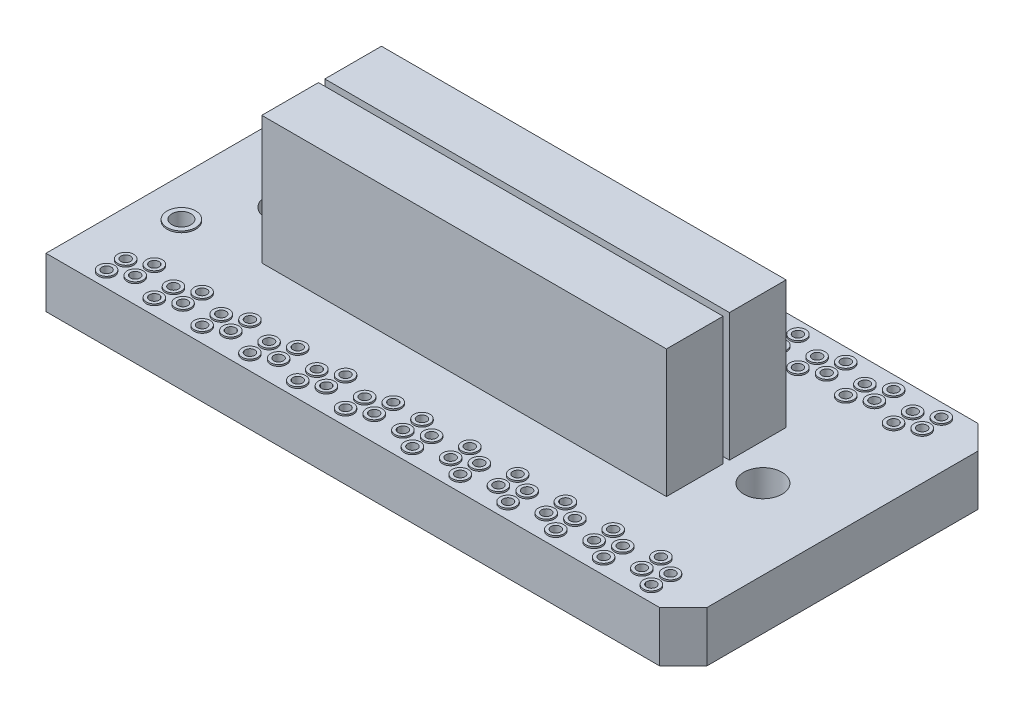
from build123d import *

# Parameters (mm, degrees)
SKETCH1_W                  = 20
SKETCH1_H                  = 10
PCB_DEPTH                  = 1.5875
SKETCH2_W                  = 12.7
SKETCH2_H                  = 1.778
CONNECTOR_DEPTH            = 4.0132
SKETCH3_R                  = 0.15
CUT_EXTRUDE1_DEPTH         = 12.878795151
BOSS_EXTRUDE3_START        = 0.05
SKETCH4_R                  = 0.25
SKETCH4_R_2                = 0.15
BOSS_EXTRUDE3_DEPTH        = 0.05
SKETCH5_R                  = 0.3
CUT_EXTRUDE2_DEPTH         = 12.878795151
BOSS_EXTRUDE4_START        = 0.05
SKETCH6_R                  = 0.45
SKETCH6_R_2                = 0.3
BOSS_EXTRUDE4_DEPTH        = 0.05
LPATTERN1_COUNT            = 6
LPATTERN1_PITCH            = 1.5
MIRROR2_COPY_1_SKETCH_R    = 0.15
MIRROR2_COPY_1_DEPTH       = 12.878795151
MIRROR2_COPY_2_SKETCH_R    = 0.15
MIRROR2_COPY_2_DEPTH       = 12.878795151
MIRROR2_COPY_3_SKETCH_R    = 0.15
MIRROR2_COPY_3_DEPTH       = 12.878795151
MIRROR2_COPY_4_SKETCH_R    = 0.15
MIRROR2_COPY_4_DEPTH       = 12.878795151
MIRROR2_COPY_5_SKETCH_R    = 0.15
MIRROR2_COPY_5_DEPTH       = 12.878795151
MIRROR2_START              = 0.05
MIRROR2_COPY_6_SKETCH_R    = 0.25
MIRROR2_COPY_6_SKETCH_R_2  = 0.15
MIRROR2_COPY_6_DEPTH       = 0.05
MIRROR2_COPY_7_SKETCH_R    = 0.25
MIRROR2_COPY_7_SKETCH_R_2  = 0.15
MIRROR2_COPY_7_DEPTH       = 0.05
MIRROR2_COPY_8_SKETCH_R    = 0.25
MIRROR2_COPY_8_SKETCH_R_2  = 0.15
MIRROR2_COPY_8_DEPTH       = 0.05
MIRROR2_COPY_9_SKETCH_R    = 0.25
MIRROR2_COPY_9_SKETCH_R_2  = 0.15
MIRROR2_COPY_9_DEPTH       = 0.05
MIRROR2_COPY_10_SKETCH_R   = 0.25
MIRROR2_COPY_10_SKETCH_R_2 = 0.15
MIRROR2_COPY_10_DEPTH      = 0.05
MIRROR2_COPY_11_SKETCH_R   = 0.15
MIRROR2_COPY_11_DEPTH      = 12.878795151
MIRROR2_COPY_12_SKETCH_R   = 0.25
MIRROR2_COPY_12_SKETCH_R_2 = 0.15
MIRROR2_COPY_12_DEPTH      = 0.05
MIRROR3_COPY_1_SKETCH_R    = 0.15
MIRROR3_COPY_1_DEPTH       = 12.878795151
MIRROR3_COPY_2_SKETCH_R    = 0.15
MIRROR3_COPY_2_DEPTH       = 12.878795151
MIRROR3_COPY_3_SKETCH_R    = 0.15
MIRROR3_COPY_3_DEPTH       = 12.878795151
MIRROR3_COPY_4_SKETCH_R    = 0.15
MIRROR3_COPY_4_DEPTH       = 12.878795151
MIRROR3_COPY_5_SKETCH_R    = 0.15
MIRROR3_COPY_5_DEPTH       = 12.878795151
MIRROR3_START              = 0.05
MIRROR3_COPY_6_SKETCH_R    = 0.25
MIRROR3_COPY_6_SKETCH_R_2  = 0.15
MIRROR3_COPY_6_DEPTH       = 0.05
MIRROR3_COPY_7_SKETCH_R    = 0.25
MIRROR3_COPY_7_SKETCH_R_2  = 0.15
MIRROR3_COPY_7_DEPTH       = 0.05
MIRROR3_COPY_8_SKETCH_R    = 0.25
MIRROR3_COPY_8_SKETCH_R_2  = 0.15
MIRROR3_COPY_8_DEPTH       = 0.05
MIRROR3_COPY_9_SKETCH_R    = 0.25
MIRROR3_COPY_9_SKETCH_R_2  = 0.15
MIRROR3_COPY_9_DEPTH       = 0.05
MIRROR3_COPY_10_SKETCH_R   = 0.25
MIRROR3_COPY_10_SKETCH_R_2 = 0.15
MIRROR3_COPY_10_DEPTH      = 0.05
MIRROR3_COPY_11_SKETCH_R   = 0.15
MIRROR3_COPY_11_DEPTH      = 12.878795151
MIRROR3_COPY_12_SKETCH_R   = 0.25
MIRROR3_COPY_12_SKETCH_R_2 = 0.15
MIRROR3_COPY_12_DEPTH      = 0.05
MIRROR3_COPY_13_SKETCH_R   = 0.15
MIRROR3_COPY_13_DEPTH      = 12.878795151
MIRROR3_COPY_14_SKETCH_R   = 0.15
MIRROR3_COPY_14_DEPTH      = 12.878795151
MIRROR3_COPY_15_SKETCH_R   = 0.15
MIRROR3_COPY_15_DEPTH      = 12.878795151
MIRROR3_COPY_16_SKETCH_R   = 0.15
MIRROR3_COPY_16_DEPTH      = 12.878795151
MIRROR3_COPY_17_SKETCH_R   = 0.15
MIRROR3_COPY_17_DEPTH      = 12.878795151
MIRROR3_COPY_18_SKETCH_R   = 0.25
MIRROR3_COPY_18_SKETCH_R_2 = 0.15
MIRROR3_COPY_18_DEPTH      = 0.05
MIRROR3_COPY_19_SKETCH_R   = 0.25
MIRROR3_COPY_19_SKETCH_R_2 = 0.15
MIRROR3_COPY_19_DEPTH      = 0.05
MIRROR3_COPY_20_SKETCH_R   = 0.25
MIRROR3_COPY_20_SKETCH_R_2 = 0.15
MIRROR3_COPY_20_DEPTH      = 0.05
MIRROR3_COPY_21_SKETCH_R   = 0.25
MIRROR3_COPY_21_SKETCH_R_2 = 0.15
MIRROR3_COPY_21_DEPTH      = 0.05
MIRROR3_COPY_22_SKETCH_R   = 0.25
MIRROR3_COPY_22_SKETCH_R_2 = 0.15
MIRROR3_COPY_22_DEPTH      = 0.05
MIRROR3_COPY_23_SKETCH_R   = 0.15
MIRROR3_COPY_23_DEPTH      = 12.878795151
MIRROR3_COPY_24_SKETCH_R   = 0.25
MIRROR3_COPY_24_SKETCH_R_2 = 0.15
MIRROR3_COPY_24_DEPTH      = 0.05
MIRROR3_COPY_25_SKETCH_R   = 0.15
MIRROR3_COPY_25_DEPTH      = 12.878795151
MIRROR3_COPY_26_SKETCH_R   = 0.25
MIRROR3_COPY_26_SKETCH_R_2 = 0.15
MIRROR3_COPY_26_DEPTH      = 0.05
CHAMFER1_SIZE              = 0.75
SKETCH8_W                  = 0.288461539
SKETCH8_H                  = 1.5
BOSS_EXTRUDE5_DEPTH        = 0.01
SKETCH9_R                  = 0.6
CUT_EXTRUDE3_DEPTH         = 10


with BuildPart() as part:
    # Sketch1 → PCB (new body)
    with BuildSketch(Plane(origin=(0, 0, 0), x_dir=(1, 0, 0), z_dir=(0, 1, 0))):
        Rectangle(SKETCH1_W, SKETCH1_H)
    extrude(amount=PCB_DEPTH)

    # Sketch2 → Connector (add)
    with BuildSketch(Plane(origin=(0, 1.5875, 0), x_dir=(1, 0, 0), z_dir=(0, 1, 0))):
        with Locations((0, -0.989)):
            Rectangle(SKETCH2_W, SKETCH2_H)
    connector = extrude(amount=CONNECTOR_DEPTH)

    # Mirror1: Connector across plane
    add(connector.mirror(Plane.XY))

    # Sketch3 → Cut-Extrude1 (cut, through all)
    with BuildSketch(Plane(origin=(0, 1.5875, 0), x_dir=(1, 0, 0), z_dir=(0, 1, 0))):
        with Locations((-0.45, -3.65)):
            Circle(SKETCH3_R)
        with Locations((-0.45, -4.25)):
            Circle(SKETCH3_R)
        with Locations((-1.05, -3.95)):
            Circle(SKETCH3_R)
        with Locations((-1.05, -4.55)):
            Circle(SKETCH3_R)
    cut_extrude1 = extrude(amount=-CUT_EXTRUDE1_DEPTH, mode=Mode.SUBTRACT)

    # Sketch4 → Boss-Extrude3 (add)
    # profile 1 of 4: a face of its own
    with BuildSketch(Plane(origin=(0, 1.5875, 0), x_dir=(1, 0, 0), z_dir=(0, 1, 0)).offset(BOSS_EXTRUDE3_START)):
        with Locations((-1.05, -4.55)):
            Circle(SKETCH4_R)
        with Locations((-1.05, -4.55)):
            Circle(SKETCH4_R_2, mode=Mode.SUBTRACT)
    # profile 2 of 4: a face of its own
    with BuildSketch(Plane(origin=(0, 1.5875, 0), x_dir=(1, 0, 0), z_dir=(0, 1, 0)).offset(BOSS_EXTRUDE3_START)):
        with Locations((-0.45, -4.25)):
            Circle(SKETCH4_R)
        with Locations((-0.45, -4.25)):
            Circle(SKETCH4_R_2, mode=Mode.SUBTRACT)
    # profile 3 of 4: a face of its own
    with BuildSketch(Plane(origin=(0, 1.5875, 0), x_dir=(1, 0, 0), z_dir=(0, 1, 0)).offset(BOSS_EXTRUDE3_START)):
        with Locations((-0.45, -3.65)):
            Circle(SKETCH4_R)
        with Locations((-0.45, -3.65)):
            Circle(SKETCH4_R_2, mode=Mode.SUBTRACT)
    # profile 4 of 4: a face of its own
    with BuildSketch(Plane(origin=(0, 1.5875, 0), x_dir=(1, 0, 0), z_dir=(0, 1, 0)).offset(BOSS_EXTRUDE3_START)):
        with Locations((-1.05, -3.95)):
            Circle(SKETCH4_R)
        with Locations((-1.05, -3.95)):
            Circle(SKETCH4_R_2, mode=Mode.SUBTRACT)
    boss_extrude3 = extrude(amount=-BOSS_EXTRUDE3_DEPTH)

    # Sketch5 → Cut-Extrude2 (cut, through all)
    with BuildSketch(Plane(origin=(0, 1.5875, 0), x_dir=(1, 0, 0), z_dir=(0, 1, 0))):
        with Locations((-8.75, -2)):
            Circle(SKETCH5_R)
    cut_extrude2 = extrude(amount=-CUT_EXTRUDE2_DEPTH, mode=Mode.SUBTRACT)

    # Sketch6 → Boss-Extrude4 (add)
    with BuildSketch(Plane(origin=(0, 1.5875, 0), x_dir=(1, 0, 0), z_dir=(0, 1, 0)).offset(BOSS_EXTRUDE4_START)):
        with Locations((-8.75, -2)):
            Circle(SKETCH6_R)
        with Locations((-8.75, -2)):
            Circle(SKETCH6_R_2, mode=Mode.SUBTRACT)
    boss_extrude4 = extrude(amount=-BOSS_EXTRUDE4_DEPTH)

    # LPattern1: Cut-Extrude1, Boss-Extrude3 ×6
    with Locations(*[(-i * LPATTERN1_PITCH, 0, 0) for i in range(1, LPATTERN1_COUNT)]):
        add(cut_extrude1, mode=Mode.SUBTRACT)
        add(boss_extrude3)

    # Mirror2 copy 1 sketch → Mirror2 copy 1 (cut, through all)
    with BuildSketch(Plane(origin=(1.5, 1.5875, 0), x_dir=(-1, 0, 0), z_dir=(0, 1, 0))):
        with Locations((-0.45, 3.65)):
            Circle(MIRROR2_COPY_1_SKETCH_R)
        with Locations((-0.45, 4.25)):
            Circle(MIRROR2_COPY_1_SKETCH_R)
        with Locations((-1.05, 3.95)):
            Circle(MIRROR2_COPY_1_SKETCH_R)
        with Locations((-1.05, 4.55)):
            Circle(MIRROR2_COPY_1_SKETCH_R)
    extrude(amount=-MIRROR2_COPY_1_DEPTH, mode=Mode.SUBTRACT)

    # Mirror2 copy 2 sketch → Mirror2 copy 2 (cut, through all)
    with BuildSketch(Plane(origin=(3, 1.5875, 0), x_dir=(-1, 0, 0), z_dir=(0, 1, 0))):
        with Locations((-0.45, 3.65)):
            Circle(MIRROR2_COPY_2_SKETCH_R)
        with Locations((-0.45, 4.25)):
            Circle(MIRROR2_COPY_2_SKETCH_R)
        with Locations((-1.05, 3.95)):
            Circle(MIRROR2_COPY_2_SKETCH_R)
        with Locations((-1.05, 4.55)):
            Circle(MIRROR2_COPY_2_SKETCH_R)
    extrude(amount=-MIRROR2_COPY_2_DEPTH, mode=Mode.SUBTRACT)

    # Mirror2 copy 3 sketch → Mirror2 copy 3 (cut, through all)
    with BuildSketch(Plane(origin=(4.5, 1.5875, 0), x_dir=(-1, 0, 0), z_dir=(0, 1, 0))):
        with Locations((-0.45, 3.65)):
            Circle(MIRROR2_COPY_3_SKETCH_R)
        with Locations((-0.45, 4.25)):
            Circle(MIRROR2_COPY_3_SKETCH_R)
        with Locations((-1.05, 3.95)):
            Circle(MIRROR2_COPY_3_SKETCH_R)
        with Locations((-1.05, 4.55)):
            Circle(MIRROR2_COPY_3_SKETCH_R)
    extrude(amount=-MIRROR2_COPY_3_DEPTH, mode=Mode.SUBTRACT)

    # Mirror2 copy 4 sketch → Mirror2 copy 4 (cut, through all)
    with BuildSketch(Plane(origin=(6, 1.5875, 0), x_dir=(-1, 0, 0), z_dir=(0, 1, 0))):
        with Locations((-0.45, 3.65)):
            Circle(MIRROR2_COPY_4_SKETCH_R)
        with Locations((-0.45, 4.25)):
            Circle(MIRROR2_COPY_4_SKETCH_R)
        with Locations((-1.05, 3.95)):
            Circle(MIRROR2_COPY_4_SKETCH_R)
        with Locations((-1.05, 4.55)):
            Circle(MIRROR2_COPY_4_SKETCH_R)
    extrude(amount=-MIRROR2_COPY_4_DEPTH, mode=Mode.SUBTRACT)

    # Mirror2 copy 5 sketch → Mirror2 copy 5 (cut, through all)
    with BuildSketch(Plane(origin=(7.5, 1.5875, 0), x_dir=(-1, 0, 0), z_dir=(0, 1, 0))):
        with Locations((-0.45, 3.65)):
            Circle(MIRROR2_COPY_5_SKETCH_R)
        with Locations((-0.45, 4.25)):
            Circle(MIRROR2_COPY_5_SKETCH_R)
        with Locations((-1.05, 3.95)):
            Circle(MIRROR2_COPY_5_SKETCH_R)
        with Locations((-1.05, 4.55)):
            Circle(MIRROR2_COPY_5_SKETCH_R)
    extrude(amount=-MIRROR2_COPY_5_DEPTH, mode=Mode.SUBTRACT)

    # Mirror2 copy 6 sketch → Mirror2 copy 6 (add)
    # profile 1 of 4: a face of its own
    with BuildSketch(Plane(origin=(1.5, 1.5875, 0), x_dir=(-1, 0, 0), z_dir=(0, 1, 0)).offset(MIRROR2_START)):
        with Locations((-1.05, 4.55)):
            Circle(MIRROR2_COPY_6_SKETCH_R)
        with Locations((-1.05, 4.55)):
            Circle(MIRROR2_COPY_6_SKETCH_R_2, mode=Mode.SUBTRACT)
    # profile 2 of 4: a face of its own
    with BuildSketch(Plane(origin=(1.5, 1.5875, 0), x_dir=(-1, 0, 0), z_dir=(0, 1, 0)).offset(MIRROR2_START)):
        with Locations((-0.45, 4.25)):
            Circle(MIRROR2_COPY_6_SKETCH_R)
        with Locations((-0.45, 4.25)):
            Circle(MIRROR2_COPY_6_SKETCH_R_2, mode=Mode.SUBTRACT)
    # profile 3 of 4: a face of its own
    with BuildSketch(Plane(origin=(1.5, 1.5875, 0), x_dir=(-1, 0, 0), z_dir=(0, 1, 0)).offset(MIRROR2_START)):
        with Locations((-0.45, 3.65)):
            Circle(MIRROR2_COPY_6_SKETCH_R)
        with Locations((-0.45, 3.65)):
            Circle(MIRROR2_COPY_6_SKETCH_R_2, mode=Mode.SUBTRACT)
    # profile 4 of 4: a face of its own
    with BuildSketch(Plane(origin=(1.5, 1.5875, 0), x_dir=(-1, 0, 0), z_dir=(0, 1, 0)).offset(MIRROR2_START)):
        with Locations((-1.05, 3.95)):
            Circle(MIRROR2_COPY_6_SKETCH_R)
        with Locations((-1.05, 3.95)):
            Circle(MIRROR2_COPY_6_SKETCH_R_2, mode=Mode.SUBTRACT)
    extrude(amount=-MIRROR2_COPY_6_DEPTH)

    # Mirror2 copy 7 sketch → Mirror2 copy 7 (add)
    # profile 1 of 4: a face of its own
    with BuildSketch(Plane(origin=(3, 1.5875, 0), x_dir=(-1, 0, 0), z_dir=(0, 1, 0)).offset(MIRROR2_START)):
        with Locations((-1.05, 4.55)):
            Circle(MIRROR2_COPY_7_SKETCH_R)
        with Locations((-1.05, 4.55)):
            Circle(MIRROR2_COPY_7_SKETCH_R_2, mode=Mode.SUBTRACT)
    # profile 2 of 4: a face of its own
    with BuildSketch(Plane(origin=(3, 1.5875, 0), x_dir=(-1, 0, 0), z_dir=(0, 1, 0)).offset(MIRROR2_START)):
        with Locations((-0.45, 4.25)):
            Circle(MIRROR2_COPY_7_SKETCH_R)
        with Locations((-0.45, 4.25)):
            Circle(MIRROR2_COPY_7_SKETCH_R_2, mode=Mode.SUBTRACT)
    # profile 3 of 4: a face of its own
    with BuildSketch(Plane(origin=(3, 1.5875, 0), x_dir=(-1, 0, 0), z_dir=(0, 1, 0)).offset(MIRROR2_START)):
        with Locations((-0.45, 3.65)):
            Circle(MIRROR2_COPY_7_SKETCH_R)
        with Locations((-0.45, 3.65)):
            Circle(MIRROR2_COPY_7_SKETCH_R_2, mode=Mode.SUBTRACT)
    # profile 4 of 4: a face of its own
    with BuildSketch(Plane(origin=(3, 1.5875, 0), x_dir=(-1, 0, 0), z_dir=(0, 1, 0)).offset(MIRROR2_START)):
        with Locations((-1.05, 3.95)):
            Circle(MIRROR2_COPY_7_SKETCH_R)
        with Locations((-1.05, 3.95)):
            Circle(MIRROR2_COPY_7_SKETCH_R_2, mode=Mode.SUBTRACT)
    extrude(amount=-MIRROR2_COPY_7_DEPTH)

    # Mirror2 copy 8 sketch → Mirror2 copy 8 (add)
    # profile 1 of 4: a face of its own
    with BuildSketch(Plane(origin=(4.5, 1.5875, 0), x_dir=(-1, 0, 0), z_dir=(0, 1, 0)).offset(MIRROR2_START)):
        with Locations((-1.05, 4.55)):
            Circle(MIRROR2_COPY_8_SKETCH_R)
        with Locations((-1.05, 4.55)):
            Circle(MIRROR2_COPY_8_SKETCH_R_2, mode=Mode.SUBTRACT)
    # profile 2 of 4: a face of its own
    with BuildSketch(Plane(origin=(4.5, 1.5875, 0), x_dir=(-1, 0, 0), z_dir=(0, 1, 0)).offset(MIRROR2_START)):
        with Locations((-0.45, 4.25)):
            Circle(MIRROR2_COPY_8_SKETCH_R)
        with Locations((-0.45, 4.25)):
            Circle(MIRROR2_COPY_8_SKETCH_R_2, mode=Mode.SUBTRACT)
    # profile 3 of 4: a face of its own
    with BuildSketch(Plane(origin=(4.5, 1.5875, 0), x_dir=(-1, 0, 0), z_dir=(0, 1, 0)).offset(MIRROR2_START)):
        with Locations((-0.45, 3.65)):
            Circle(MIRROR2_COPY_8_SKETCH_R)
        with Locations((-0.45, 3.65)):
            Circle(MIRROR2_COPY_8_SKETCH_R_2, mode=Mode.SUBTRACT)
    # profile 4 of 4: a face of its own
    with BuildSketch(Plane(origin=(4.5, 1.5875, 0), x_dir=(-1, 0, 0), z_dir=(0, 1, 0)).offset(MIRROR2_START)):
        with Locations((-1.05, 3.95)):
            Circle(MIRROR2_COPY_8_SKETCH_R)
        with Locations((-1.05, 3.95)):
            Circle(MIRROR2_COPY_8_SKETCH_R_2, mode=Mode.SUBTRACT)
    extrude(amount=-MIRROR2_COPY_8_DEPTH)

    # Mirror2 copy 9 sketch → Mirror2 copy 9 (add)
    # profile 1 of 4: a face of its own
    with BuildSketch(Plane(origin=(6, 1.5875, 0), x_dir=(-1, 0, 0), z_dir=(0, 1, 0)).offset(MIRROR2_START)):
        with Locations((-1.05, 4.55)):
            Circle(MIRROR2_COPY_9_SKETCH_R)
        with Locations((-1.05, 4.55)):
            Circle(MIRROR2_COPY_9_SKETCH_R_2, mode=Mode.SUBTRACT)
    # profile 2 of 4: a face of its own
    with BuildSketch(Plane(origin=(6, 1.5875, 0), x_dir=(-1, 0, 0), z_dir=(0, 1, 0)).offset(MIRROR2_START)):
        with Locations((-0.45, 4.25)):
            Circle(MIRROR2_COPY_9_SKETCH_R)
        with Locations((-0.45, 4.25)):
            Circle(MIRROR2_COPY_9_SKETCH_R_2, mode=Mode.SUBTRACT)
    # profile 3 of 4: a face of its own
    with BuildSketch(Plane(origin=(6, 1.5875, 0), x_dir=(-1, 0, 0), z_dir=(0, 1, 0)).offset(MIRROR2_START)):
        with Locations((-0.45, 3.65)):
            Circle(MIRROR2_COPY_9_SKETCH_R)
        with Locations((-0.45, 3.65)):
            Circle(MIRROR2_COPY_9_SKETCH_R_2, mode=Mode.SUBTRACT)
    # profile 4 of 4: a face of its own
    with BuildSketch(Plane(origin=(6, 1.5875, 0), x_dir=(-1, 0, 0), z_dir=(0, 1, 0)).offset(MIRROR2_START)):
        with Locations((-1.05, 3.95)):
            Circle(MIRROR2_COPY_9_SKETCH_R)
        with Locations((-1.05, 3.95)):
            Circle(MIRROR2_COPY_9_SKETCH_R_2, mode=Mode.SUBTRACT)
    extrude(amount=-MIRROR2_COPY_9_DEPTH)

    # Mirror2 copy 10 sketch → Mirror2 copy 10 (add)
    # profile 1 of 4: a face of its own
    with BuildSketch(Plane(origin=(7.5, 1.5875, 0), x_dir=(-1, 0, 0), z_dir=(0, 1, 0)).offset(MIRROR2_START)):
        with Locations((-1.05, 4.55)):
            Circle(MIRROR2_COPY_10_SKETCH_R)
        with Locations((-1.05, 4.55)):
            Circle(MIRROR2_COPY_10_SKETCH_R_2, mode=Mode.SUBTRACT)
    # profile 2 of 4: a face of its own
    with BuildSketch(Plane(origin=(7.5, 1.5875, 0), x_dir=(-1, 0, 0), z_dir=(0, 1, 0)).offset(MIRROR2_START)):
        with Locations((-0.45, 4.25)):
            Circle(MIRROR2_COPY_10_SKETCH_R)
        with Locations((-0.45, 4.25)):
            Circle(MIRROR2_COPY_10_SKETCH_R_2, mode=Mode.SUBTRACT)
    # profile 3 of 4: a face of its own
    with BuildSketch(Plane(origin=(7.5, 1.5875, 0), x_dir=(-1, 0, 0), z_dir=(0, 1, 0)).offset(MIRROR2_START)):
        with Locations((-0.45, 3.65)):
            Circle(MIRROR2_COPY_10_SKETCH_R)
        with Locations((-0.45, 3.65)):
            Circle(MIRROR2_COPY_10_SKETCH_R_2, mode=Mode.SUBTRACT)
    # profile 4 of 4: a face of its own
    with BuildSketch(Plane(origin=(7.5, 1.5875, 0), x_dir=(-1, 0, 0), z_dir=(0, 1, 0)).offset(MIRROR2_START)):
        with Locations((-1.05, 3.95)):
            Circle(MIRROR2_COPY_10_SKETCH_R)
        with Locations((-1.05, 3.95)):
            Circle(MIRROR2_COPY_10_SKETCH_R_2, mode=Mode.SUBTRACT)
    extrude(amount=-MIRROR2_COPY_10_DEPTH)

    # Mirror2 copy 11 sketch → Mirror2 copy 11 (cut, through all)
    with BuildSketch(Plane(origin=(0, 1.5875, 0), x_dir=(-1, 0, 0), z_dir=(0, 1, 0))):
        with Locations((-0.45, 3.65)):
            Circle(MIRROR2_COPY_11_SKETCH_R)
        with Locations((-0.45, 4.25)):
            Circle(MIRROR2_COPY_11_SKETCH_R)
        with Locations((-1.05, 3.95)):
            Circle(MIRROR2_COPY_11_SKETCH_R)
        with Locations((-1.05, 4.55)):
            Circle(MIRROR2_COPY_11_SKETCH_R)
    extrude(amount=-MIRROR2_COPY_11_DEPTH, mode=Mode.SUBTRACT)

    # Mirror2 copy 12 sketch → Mirror2 copy 12 (add)
    # profile 1 of 4: a face of its own
    with BuildSketch(Plane(origin=(0, 1.5875, 0), x_dir=(-1, 0, 0), z_dir=(0, 1, 0)).offset(MIRROR2_START)):
        with Locations((-1.05, 4.55)):
            Circle(MIRROR2_COPY_12_SKETCH_R)
        with Locations((-1.05, 4.55)):
            Circle(MIRROR2_COPY_12_SKETCH_R_2, mode=Mode.SUBTRACT)
    # profile 2 of 4: a face of its own
    with BuildSketch(Plane(origin=(0, 1.5875, 0), x_dir=(-1, 0, 0), z_dir=(0, 1, 0)).offset(MIRROR2_START)):
        with Locations((-0.45, 4.25)):
            Circle(MIRROR2_COPY_12_SKETCH_R)
        with Locations((-0.45, 4.25)):
            Circle(MIRROR2_COPY_12_SKETCH_R_2, mode=Mode.SUBTRACT)
    # profile 3 of 4: a face of its own
    with BuildSketch(Plane(origin=(0, 1.5875, 0), x_dir=(-1, 0, 0), z_dir=(0, 1, 0)).offset(MIRROR2_START)):
        with Locations((-0.45, 3.65)):
            Circle(MIRROR2_COPY_12_SKETCH_R)
        with Locations((-0.45, 3.65)):
            Circle(MIRROR2_COPY_12_SKETCH_R_2, mode=Mode.SUBTRACT)
    # profile 4 of 4: a face of its own
    with BuildSketch(Plane(origin=(0, 1.5875, 0), x_dir=(-1, 0, 0), z_dir=(0, 1, 0)).offset(MIRROR2_START)):
        with Locations((-1.05, 3.95)):
            Circle(MIRROR2_COPY_12_SKETCH_R)
        with Locations((-1.05, 3.95)):
            Circle(MIRROR2_COPY_12_SKETCH_R_2, mode=Mode.SUBTRACT)
    extrude(amount=-MIRROR2_COPY_12_DEPTH)

    # Mirror3: Cut-Extrude2, Boss-Extrude4 across plane
    add(cut_extrude2.mirror(Plane.XY), mode=Mode.SUBTRACT)
    add(boss_extrude4.mirror(Plane.XY))

    # Mirror3 copy 1 sketch → Mirror3 copy 1 (cut, through all)
    with BuildSketch(Plane(origin=(-1.5, 1.5875, 0), x_dir=(1, 0, 0), z_dir=(0, 1, 0))):
        with Locations((-0.45, 3.65)):
            Circle(MIRROR3_COPY_1_SKETCH_R)
        with Locations((-0.45, 4.25)):
            Circle(MIRROR3_COPY_1_SKETCH_R)
        with Locations((-1.05, 3.95)):
            Circle(MIRROR3_COPY_1_SKETCH_R)
        with Locations((-1.05, 4.55)):
            Circle(MIRROR3_COPY_1_SKETCH_R)
    extrude(amount=-MIRROR3_COPY_1_DEPTH, mode=Mode.SUBTRACT)

    # Mirror3 copy 2 sketch → Mirror3 copy 2 (cut, through all)
    with BuildSketch(Plane(origin=(-3, 1.5875, 0), x_dir=(1, 0, 0), z_dir=(0, 1, 0))):
        with Locations((-0.45, 3.65)):
            Circle(MIRROR3_COPY_2_SKETCH_R)
        with Locations((-0.45, 4.25)):
            Circle(MIRROR3_COPY_2_SKETCH_R)
        with Locations((-1.05, 3.95)):
            Circle(MIRROR3_COPY_2_SKETCH_R)
        with Locations((-1.05, 4.55)):
            Circle(MIRROR3_COPY_2_SKETCH_R)
    extrude(amount=-MIRROR3_COPY_2_DEPTH, mode=Mode.SUBTRACT)

    # Mirror3 copy 3 sketch → Mirror3 copy 3 (cut, through all)
    with BuildSketch(Plane(origin=(-4.5, 1.5875, 0), x_dir=(1, 0, 0), z_dir=(0, 1, 0))):
        with Locations((-0.45, 3.65)):
            Circle(MIRROR3_COPY_3_SKETCH_R)
        with Locations((-0.45, 4.25)):
            Circle(MIRROR3_COPY_3_SKETCH_R)
        with Locations((-1.05, 3.95)):
            Circle(MIRROR3_COPY_3_SKETCH_R)
        with Locations((-1.05, 4.55)):
            Circle(MIRROR3_COPY_3_SKETCH_R)
    extrude(amount=-MIRROR3_COPY_3_DEPTH, mode=Mode.SUBTRACT)

    # Mirror3 copy 4 sketch → Mirror3 copy 4 (cut, through all)
    with BuildSketch(Plane(origin=(-6, 1.5875, 0), x_dir=(1, 0, 0), z_dir=(0, 1, 0))):
        with Locations((-0.45, 3.65)):
            Circle(MIRROR3_COPY_4_SKETCH_R)
        with Locations((-0.45, 4.25)):
            Circle(MIRROR3_COPY_4_SKETCH_R)
        with Locations((-1.05, 3.95)):
            Circle(MIRROR3_COPY_4_SKETCH_R)
        with Locations((-1.05, 4.55)):
            Circle(MIRROR3_COPY_4_SKETCH_R)
    extrude(amount=-MIRROR3_COPY_4_DEPTH, mode=Mode.SUBTRACT)

    # Mirror3 copy 5 sketch → Mirror3 copy 5 (cut, through all)
    with BuildSketch(Plane(origin=(-7.5, 1.5875, 0), x_dir=(1, 0, 0), z_dir=(0, 1, 0))):
        with Locations((-0.45, 3.65)):
            Circle(MIRROR3_COPY_5_SKETCH_R)
        with Locations((-0.45, 4.25)):
            Circle(MIRROR3_COPY_5_SKETCH_R)
        with Locations((-1.05, 3.95)):
            Circle(MIRROR3_COPY_5_SKETCH_R)
        with Locations((-1.05, 4.55)):
            Circle(MIRROR3_COPY_5_SKETCH_R)
    extrude(amount=-MIRROR3_COPY_5_DEPTH, mode=Mode.SUBTRACT)

    # Mirror3 copy 6 sketch → Mirror3 copy 6 (add)
    # profile 1 of 4: a face of its own
    with BuildSketch(Plane(origin=(-1.5, 1.5875, 0), x_dir=(1, 0, 0), z_dir=(0, 1, 0)).offset(MIRROR3_START)):
        with Locations((-1.05, 4.55)):
            Circle(MIRROR3_COPY_6_SKETCH_R)
        with Locations((-1.05, 4.55)):
            Circle(MIRROR3_COPY_6_SKETCH_R_2, mode=Mode.SUBTRACT)
    # profile 2 of 4: a face of its own
    with BuildSketch(Plane(origin=(-1.5, 1.5875, 0), x_dir=(1, 0, 0), z_dir=(0, 1, 0)).offset(MIRROR3_START)):
        with Locations((-0.45, 4.25)):
            Circle(MIRROR3_COPY_6_SKETCH_R)
        with Locations((-0.45, 4.25)):
            Circle(MIRROR3_COPY_6_SKETCH_R_2, mode=Mode.SUBTRACT)
    # profile 3 of 4: a face of its own
    with BuildSketch(Plane(origin=(-1.5, 1.5875, 0), x_dir=(1, 0, 0), z_dir=(0, 1, 0)).offset(MIRROR3_START)):
        with Locations((-0.45, 3.65)):
            Circle(MIRROR3_COPY_6_SKETCH_R)
        with Locations((-0.45, 3.65)):
            Circle(MIRROR3_COPY_6_SKETCH_R_2, mode=Mode.SUBTRACT)
    # profile 4 of 4: a face of its own
    with BuildSketch(Plane(origin=(-1.5, 1.5875, 0), x_dir=(1, 0, 0), z_dir=(0, 1, 0)).offset(MIRROR3_START)):
        with Locations((-1.05, 3.95)):
            Circle(MIRROR3_COPY_6_SKETCH_R)
        with Locations((-1.05, 3.95)):
            Circle(MIRROR3_COPY_6_SKETCH_R_2, mode=Mode.SUBTRACT)
    extrude(amount=-MIRROR3_COPY_6_DEPTH)

    # Mirror3 copy 7 sketch → Mirror3 copy 7 (add)
    # profile 1 of 4: a face of its own
    with BuildSketch(Plane(origin=(-3, 1.5875, 0), x_dir=(1, 0, 0), z_dir=(0, 1, 0)).offset(MIRROR3_START)):
        with Locations((-1.05, 4.55)):
            Circle(MIRROR3_COPY_7_SKETCH_R)
        with Locations((-1.05, 4.55)):
            Circle(MIRROR3_COPY_7_SKETCH_R_2, mode=Mode.SUBTRACT)
    # profile 2 of 4: a face of its own
    with BuildSketch(Plane(origin=(-3, 1.5875, 0), x_dir=(1, 0, 0), z_dir=(0, 1, 0)).offset(MIRROR3_START)):
        with Locations((-0.45, 4.25)):
            Circle(MIRROR3_COPY_7_SKETCH_R)
        with Locations((-0.45, 4.25)):
            Circle(MIRROR3_COPY_7_SKETCH_R_2, mode=Mode.SUBTRACT)
    # profile 3 of 4: a face of its own
    with BuildSketch(Plane(origin=(-3, 1.5875, 0), x_dir=(1, 0, 0), z_dir=(0, 1, 0)).offset(MIRROR3_START)):
        with Locations((-0.45, 3.65)):
            Circle(MIRROR3_COPY_7_SKETCH_R)
        with Locations((-0.45, 3.65)):
            Circle(MIRROR3_COPY_7_SKETCH_R_2, mode=Mode.SUBTRACT)
    # profile 4 of 4: a face of its own
    with BuildSketch(Plane(origin=(-3, 1.5875, 0), x_dir=(1, 0, 0), z_dir=(0, 1, 0)).offset(MIRROR3_START)):
        with Locations((-1.05, 3.95)):
            Circle(MIRROR3_COPY_7_SKETCH_R)
        with Locations((-1.05, 3.95)):
            Circle(MIRROR3_COPY_7_SKETCH_R_2, mode=Mode.SUBTRACT)
    extrude(amount=-MIRROR3_COPY_7_DEPTH)

    # Mirror3 copy 8 sketch → Mirror3 copy 8 (add)
    # profile 1 of 4: a face of its own
    with BuildSketch(Plane(origin=(-4.5, 1.5875, 0), x_dir=(1, 0, 0), z_dir=(0, 1, 0)).offset(MIRROR3_START)):
        with Locations((-1.05, 4.55)):
            Circle(MIRROR3_COPY_8_SKETCH_R)
        with Locations((-1.05, 4.55)):
            Circle(MIRROR3_COPY_8_SKETCH_R_2, mode=Mode.SUBTRACT)
    # profile 2 of 4: a face of its own
    with BuildSketch(Plane(origin=(-4.5, 1.5875, 0), x_dir=(1, 0, 0), z_dir=(0, 1, 0)).offset(MIRROR3_START)):
        with Locations((-0.45, 4.25)):
            Circle(MIRROR3_COPY_8_SKETCH_R)
        with Locations((-0.45, 4.25)):
            Circle(MIRROR3_COPY_8_SKETCH_R_2, mode=Mode.SUBTRACT)
    # profile 3 of 4: a face of its own
    with BuildSketch(Plane(origin=(-4.5, 1.5875, 0), x_dir=(1, 0, 0), z_dir=(0, 1, 0)).offset(MIRROR3_START)):
        with Locations((-0.45, 3.65)):
            Circle(MIRROR3_COPY_8_SKETCH_R)
        with Locations((-0.45, 3.65)):
            Circle(MIRROR3_COPY_8_SKETCH_R_2, mode=Mode.SUBTRACT)
    # profile 4 of 4: a face of its own
    with BuildSketch(Plane(origin=(-4.5, 1.5875, 0), x_dir=(1, 0, 0), z_dir=(0, 1, 0)).offset(MIRROR3_START)):
        with Locations((-1.05, 3.95)):
            Circle(MIRROR3_COPY_8_SKETCH_R)
        with Locations((-1.05, 3.95)):
            Circle(MIRROR3_COPY_8_SKETCH_R_2, mode=Mode.SUBTRACT)
    extrude(amount=-MIRROR3_COPY_8_DEPTH)

    # Mirror3 copy 9 sketch → Mirror3 copy 9 (add)
    # profile 1 of 4: a face of its own
    with BuildSketch(Plane(origin=(-6, 1.5875, 0), x_dir=(1, 0, 0), z_dir=(0, 1, 0)).offset(MIRROR3_START)):
        with Locations((-1.05, 4.55)):
            Circle(MIRROR3_COPY_9_SKETCH_R)
        with Locations((-1.05, 4.55)):
            Circle(MIRROR3_COPY_9_SKETCH_R_2, mode=Mode.SUBTRACT)
    # profile 2 of 4: a face of its own
    with BuildSketch(Plane(origin=(-6, 1.5875, 0), x_dir=(1, 0, 0), z_dir=(0, 1, 0)).offset(MIRROR3_START)):
        with Locations((-0.45, 4.25)):
            Circle(MIRROR3_COPY_9_SKETCH_R)
        with Locations((-0.45, 4.25)):
            Circle(MIRROR3_COPY_9_SKETCH_R_2, mode=Mode.SUBTRACT)
    # profile 3 of 4: a face of its own
    with BuildSketch(Plane(origin=(-6, 1.5875, 0), x_dir=(1, 0, 0), z_dir=(0, 1, 0)).offset(MIRROR3_START)):
        with Locations((-0.45, 3.65)):
            Circle(MIRROR3_COPY_9_SKETCH_R)
        with Locations((-0.45, 3.65)):
            Circle(MIRROR3_COPY_9_SKETCH_R_2, mode=Mode.SUBTRACT)
    # profile 4 of 4: a face of its own
    with BuildSketch(Plane(origin=(-6, 1.5875, 0), x_dir=(1, 0, 0), z_dir=(0, 1, 0)).offset(MIRROR3_START)):
        with Locations((-1.05, 3.95)):
            Circle(MIRROR3_COPY_9_SKETCH_R)
        with Locations((-1.05, 3.95)):
            Circle(MIRROR3_COPY_9_SKETCH_R_2, mode=Mode.SUBTRACT)
    extrude(amount=-MIRROR3_COPY_9_DEPTH)

    # Mirror3 copy 10 sketch → Mirror3 copy 10 (add)
    # profile 1 of 4: a face of its own
    with BuildSketch(Plane(origin=(-7.5, 1.5875, 0), x_dir=(1, 0, 0), z_dir=(0, 1, 0)).offset(MIRROR3_START)):
        with Locations((-1.05, 4.55)):
            Circle(MIRROR3_COPY_10_SKETCH_R)
        with Locations((-1.05, 4.55)):
            Circle(MIRROR3_COPY_10_SKETCH_R_2, mode=Mode.SUBTRACT)
    # profile 2 of 4: a face of its own
    with BuildSketch(Plane(origin=(-7.5, 1.5875, 0), x_dir=(1, 0, 0), z_dir=(0, 1, 0)).offset(MIRROR3_START)):
        with Locations((-0.45, 4.25)):
            Circle(MIRROR3_COPY_10_SKETCH_R)
        with Locations((-0.45, 4.25)):
            Circle(MIRROR3_COPY_10_SKETCH_R_2, mode=Mode.SUBTRACT)
    # profile 3 of 4: a face of its own
    with BuildSketch(Plane(origin=(-7.5, 1.5875, 0), x_dir=(1, 0, 0), z_dir=(0, 1, 0)).offset(MIRROR3_START)):
        with Locations((-0.45, 3.65)):
            Circle(MIRROR3_COPY_10_SKETCH_R)
        with Locations((-0.45, 3.65)):
            Circle(MIRROR3_COPY_10_SKETCH_R_2, mode=Mode.SUBTRACT)
    # profile 4 of 4: a face of its own
    with BuildSketch(Plane(origin=(-7.5, 1.5875, 0), x_dir=(1, 0, 0), z_dir=(0, 1, 0)).offset(MIRROR3_START)):
        with Locations((-1.05, 3.95)):
            Circle(MIRROR3_COPY_10_SKETCH_R)
        with Locations((-1.05, 3.95)):
            Circle(MIRROR3_COPY_10_SKETCH_R_2, mode=Mode.SUBTRACT)
    extrude(amount=-MIRROR3_COPY_10_DEPTH)

    # Mirror3 copy 11 sketch → Mirror3 copy 11 (cut, through all)
    with BuildSketch(Plane(origin=(0, 1.5875, 0), x_dir=(1, 0, 0), z_dir=(0, 1, 0))):
        with Locations((-0.45, 3.65)):
            Circle(MIRROR3_COPY_11_SKETCH_R)
        with Locations((-0.45, 4.25)):
            Circle(MIRROR3_COPY_11_SKETCH_R)
        with Locations((-1.05, 3.95)):
            Circle(MIRROR3_COPY_11_SKETCH_R)
        with Locations((-1.05, 4.55)):
            Circle(MIRROR3_COPY_11_SKETCH_R)
    extrude(amount=-MIRROR3_COPY_11_DEPTH, mode=Mode.SUBTRACT)

    # Mirror3 copy 12 sketch → Mirror3 copy 12 (add)
    # profile 1 of 4: a face of its own
    with BuildSketch(Plane(origin=(0, 1.5875, 0), x_dir=(1, 0, 0), z_dir=(0, 1, 0)).offset(MIRROR3_START)):
        with Locations((-1.05, 4.55)):
            Circle(MIRROR3_COPY_12_SKETCH_R)
        with Locations((-1.05, 4.55)):
            Circle(MIRROR3_COPY_12_SKETCH_R_2, mode=Mode.SUBTRACT)
    # profile 2 of 4: a face of its own
    with BuildSketch(Plane(origin=(0, 1.5875, 0), x_dir=(1, 0, 0), z_dir=(0, 1, 0)).offset(MIRROR3_START)):
        with Locations((-0.45, 4.25)):
            Circle(MIRROR3_COPY_12_SKETCH_R)
        with Locations((-0.45, 4.25)):
            Circle(MIRROR3_COPY_12_SKETCH_R_2, mode=Mode.SUBTRACT)
    # profile 3 of 4: a face of its own
    with BuildSketch(Plane(origin=(0, 1.5875, 0), x_dir=(1, 0, 0), z_dir=(0, 1, 0)).offset(MIRROR3_START)):
        with Locations((-0.45, 3.65)):
            Circle(MIRROR3_COPY_12_SKETCH_R)
        with Locations((-0.45, 3.65)):
            Circle(MIRROR3_COPY_12_SKETCH_R_2, mode=Mode.SUBTRACT)
    # profile 4 of 4: a face of its own
    with BuildSketch(Plane(origin=(0, 1.5875, 0), x_dir=(1, 0, 0), z_dir=(0, 1, 0)).offset(MIRROR3_START)):
        with Locations((-1.05, 3.95)):
            Circle(MIRROR3_COPY_12_SKETCH_R)
        with Locations((-1.05, 3.95)):
            Circle(MIRROR3_COPY_12_SKETCH_R_2, mode=Mode.SUBTRACT)
    extrude(amount=-MIRROR3_COPY_12_DEPTH)

    # Mirror3 copy 13 sketch → Mirror3 copy 13 (cut, through all)
    with BuildSketch(Plane(origin=(1.5, 1.5875, 0), x_dir=(-1, 0, 0), z_dir=(0, 1, 0))):
        with Locations((-0.45, -3.65)):
            Circle(MIRROR3_COPY_13_SKETCH_R)
        with Locations((-0.45, -4.25)):
            Circle(MIRROR3_COPY_13_SKETCH_R)
        with Locations((-1.05, -3.95)):
            Circle(MIRROR3_COPY_13_SKETCH_R)
        with Locations((-1.05, -4.55)):
            Circle(MIRROR3_COPY_13_SKETCH_R)
    extrude(amount=-MIRROR3_COPY_13_DEPTH, mode=Mode.SUBTRACT)

    # Mirror3 copy 14 sketch → Mirror3 copy 14 (cut, through all)
    with BuildSketch(Plane(origin=(3, 1.5875, 0), x_dir=(-1, 0, 0), z_dir=(0, 1, 0))):
        with Locations((-0.45, -3.65)):
            Circle(MIRROR3_COPY_14_SKETCH_R)
        with Locations((-0.45, -4.25)):
            Circle(MIRROR3_COPY_14_SKETCH_R)
        with Locations((-1.05, -3.95)):
            Circle(MIRROR3_COPY_14_SKETCH_R)
        with Locations((-1.05, -4.55)):
            Circle(MIRROR3_COPY_14_SKETCH_R)
    extrude(amount=-MIRROR3_COPY_14_DEPTH, mode=Mode.SUBTRACT)

    # Mirror3 copy 15 sketch → Mirror3 copy 15 (cut, through all)
    with BuildSketch(Plane(origin=(4.5, 1.5875, 0), x_dir=(-1, 0, 0), z_dir=(0, 1, 0))):
        with Locations((-0.45, -3.65)):
            Circle(MIRROR3_COPY_15_SKETCH_R)
        with Locations((-0.45, -4.25)):
            Circle(MIRROR3_COPY_15_SKETCH_R)
        with Locations((-1.05, -3.95)):
            Circle(MIRROR3_COPY_15_SKETCH_R)
        with Locations((-1.05, -4.55)):
            Circle(MIRROR3_COPY_15_SKETCH_R)
    extrude(amount=-MIRROR3_COPY_15_DEPTH, mode=Mode.SUBTRACT)

    # Mirror3 copy 16 sketch → Mirror3 copy 16 (cut, through all)
    with BuildSketch(Plane(origin=(6, 1.5875, 0), x_dir=(-1, 0, 0), z_dir=(0, 1, 0))):
        with Locations((-0.45, -3.65)):
            Circle(MIRROR3_COPY_16_SKETCH_R)
        with Locations((-0.45, -4.25)):
            Circle(MIRROR3_COPY_16_SKETCH_R)
        with Locations((-1.05, -3.95)):
            Circle(MIRROR3_COPY_16_SKETCH_R)
        with Locations((-1.05, -4.55)):
            Circle(MIRROR3_COPY_16_SKETCH_R)
    extrude(amount=-MIRROR3_COPY_16_DEPTH, mode=Mode.SUBTRACT)

    # Mirror3 copy 17 sketch → Mirror3 copy 17 (cut, through all)
    with BuildSketch(Plane(origin=(7.5, 1.5875, 0), x_dir=(-1, 0, 0), z_dir=(0, 1, 0))):
        with Locations((-0.45, -3.65)):
            Circle(MIRROR3_COPY_17_SKETCH_R)
        with Locations((-0.45, -4.25)):
            Circle(MIRROR3_COPY_17_SKETCH_R)
        with Locations((-1.05, -3.95)):
            Circle(MIRROR3_COPY_17_SKETCH_R)
        with Locations((-1.05, -4.55)):
            Circle(MIRROR3_COPY_17_SKETCH_R)
    extrude(amount=-MIRROR3_COPY_17_DEPTH, mode=Mode.SUBTRACT)

    # Mirror3 copy 18 sketch → Mirror3 copy 18 (add)
    # profile 1 of 4: a face of its own
    with BuildSketch(Plane(origin=(1.5, 1.5875, 0), x_dir=(-1, 0, 0), z_dir=(0, 1, 0)).offset(MIRROR3_START)):
        with Locations((-1.05, -4.55)):
            Circle(MIRROR3_COPY_18_SKETCH_R)
        with Locations((-1.05, -4.55)):
            Circle(MIRROR3_COPY_18_SKETCH_R_2, mode=Mode.SUBTRACT)
    # profile 2 of 4: a face of its own
    with BuildSketch(Plane(origin=(1.5, 1.5875, 0), x_dir=(-1, 0, 0), z_dir=(0, 1, 0)).offset(MIRROR3_START)):
        with Locations((-0.45, -4.25)):
            Circle(MIRROR3_COPY_18_SKETCH_R)
        with Locations((-0.45, -4.25)):
            Circle(MIRROR3_COPY_18_SKETCH_R_2, mode=Mode.SUBTRACT)
    # profile 3 of 4: a face of its own
    with BuildSketch(Plane(origin=(1.5, 1.5875, 0), x_dir=(-1, 0, 0), z_dir=(0, 1, 0)).offset(MIRROR3_START)):
        with Locations((-0.45, -3.65)):
            Circle(MIRROR3_COPY_18_SKETCH_R)
        with Locations((-0.45, -3.65)):
            Circle(MIRROR3_COPY_18_SKETCH_R_2, mode=Mode.SUBTRACT)
    # profile 4 of 4: a face of its own
    with BuildSketch(Plane(origin=(1.5, 1.5875, 0), x_dir=(-1, 0, 0), z_dir=(0, 1, 0)).offset(MIRROR3_START)):
        with Locations((-1.05, -3.95)):
            Circle(MIRROR3_COPY_18_SKETCH_R)
        with Locations((-1.05, -3.95)):
            Circle(MIRROR3_COPY_18_SKETCH_R_2, mode=Mode.SUBTRACT)
    extrude(amount=-MIRROR3_COPY_18_DEPTH)

    # Mirror3 copy 19 sketch → Mirror3 copy 19 (add)
    # profile 1 of 4: a face of its own
    with BuildSketch(Plane(origin=(3, 1.5875, 0), x_dir=(-1, 0, 0), z_dir=(0, 1, 0)).offset(MIRROR3_START)):
        with Locations((-1.05, -4.55)):
            Circle(MIRROR3_COPY_19_SKETCH_R)
        with Locations((-1.05, -4.55)):
            Circle(MIRROR3_COPY_19_SKETCH_R_2, mode=Mode.SUBTRACT)
    # profile 2 of 4: a face of its own
    with BuildSketch(Plane(origin=(3, 1.5875, 0), x_dir=(-1, 0, 0), z_dir=(0, 1, 0)).offset(MIRROR3_START)):
        with Locations((-0.45, -4.25)):
            Circle(MIRROR3_COPY_19_SKETCH_R)
        with Locations((-0.45, -4.25)):
            Circle(MIRROR3_COPY_19_SKETCH_R_2, mode=Mode.SUBTRACT)
    # profile 3 of 4: a face of its own
    with BuildSketch(Plane(origin=(3, 1.5875, 0), x_dir=(-1, 0, 0), z_dir=(0, 1, 0)).offset(MIRROR3_START)):
        with Locations((-0.45, -3.65)):
            Circle(MIRROR3_COPY_19_SKETCH_R)
        with Locations((-0.45, -3.65)):
            Circle(MIRROR3_COPY_19_SKETCH_R_2, mode=Mode.SUBTRACT)
    # profile 4 of 4: a face of its own
    with BuildSketch(Plane(origin=(3, 1.5875, 0), x_dir=(-1, 0, 0), z_dir=(0, 1, 0)).offset(MIRROR3_START)):
        with Locations((-1.05, -3.95)):
            Circle(MIRROR3_COPY_19_SKETCH_R)
        with Locations((-1.05, -3.95)):
            Circle(MIRROR3_COPY_19_SKETCH_R_2, mode=Mode.SUBTRACT)
    extrude(amount=-MIRROR3_COPY_19_DEPTH)

    # Mirror3 copy 20 sketch → Mirror3 copy 20 (add)
    # profile 1 of 4: a face of its own
    with BuildSketch(Plane(origin=(4.5, 1.5875, 0), x_dir=(-1, 0, 0), z_dir=(0, 1, 0)).offset(MIRROR3_START)):
        with Locations((-1.05, -4.55)):
            Circle(MIRROR3_COPY_20_SKETCH_R)
        with Locations((-1.05, -4.55)):
            Circle(MIRROR3_COPY_20_SKETCH_R_2, mode=Mode.SUBTRACT)
    # profile 2 of 4: a face of its own
    with BuildSketch(Plane(origin=(4.5, 1.5875, 0), x_dir=(-1, 0, 0), z_dir=(0, 1, 0)).offset(MIRROR3_START)):
        with Locations((-0.45, -4.25)):
            Circle(MIRROR3_COPY_20_SKETCH_R)
        with Locations((-0.45, -4.25)):
            Circle(MIRROR3_COPY_20_SKETCH_R_2, mode=Mode.SUBTRACT)
    # profile 3 of 4: a face of its own
    with BuildSketch(Plane(origin=(4.5, 1.5875, 0), x_dir=(-1, 0, 0), z_dir=(0, 1, 0)).offset(MIRROR3_START)):
        with Locations((-0.45, -3.65)):
            Circle(MIRROR3_COPY_20_SKETCH_R)
        with Locations((-0.45, -3.65)):
            Circle(MIRROR3_COPY_20_SKETCH_R_2, mode=Mode.SUBTRACT)
    # profile 4 of 4: a face of its own
    with BuildSketch(Plane(origin=(4.5, 1.5875, 0), x_dir=(-1, 0, 0), z_dir=(0, 1, 0)).offset(MIRROR3_START)):
        with Locations((-1.05, -3.95)):
            Circle(MIRROR3_COPY_20_SKETCH_R)
        with Locations((-1.05, -3.95)):
            Circle(MIRROR3_COPY_20_SKETCH_R_2, mode=Mode.SUBTRACT)
    extrude(amount=-MIRROR3_COPY_20_DEPTH)

    # Mirror3 copy 21 sketch → Mirror3 copy 21 (add)
    # profile 1 of 4: a face of its own
    with BuildSketch(Plane(origin=(6, 1.5875, 0), x_dir=(-1, 0, 0), z_dir=(0, 1, 0)).offset(MIRROR3_START)):
        with Locations((-1.05, -4.55)):
            Circle(MIRROR3_COPY_21_SKETCH_R)
        with Locations((-1.05, -4.55)):
            Circle(MIRROR3_COPY_21_SKETCH_R_2, mode=Mode.SUBTRACT)
    # profile 2 of 4: a face of its own
    with BuildSketch(Plane(origin=(6, 1.5875, 0), x_dir=(-1, 0, 0), z_dir=(0, 1, 0)).offset(MIRROR3_START)):
        with Locations((-0.45, -4.25)):
            Circle(MIRROR3_COPY_21_SKETCH_R)
        with Locations((-0.45, -4.25)):
            Circle(MIRROR3_COPY_21_SKETCH_R_2, mode=Mode.SUBTRACT)
    # profile 3 of 4: a face of its own
    with BuildSketch(Plane(origin=(6, 1.5875, 0), x_dir=(-1, 0, 0), z_dir=(0, 1, 0)).offset(MIRROR3_START)):
        with Locations((-0.45, -3.65)):
            Circle(MIRROR3_COPY_21_SKETCH_R)
        with Locations((-0.45, -3.65)):
            Circle(MIRROR3_COPY_21_SKETCH_R_2, mode=Mode.SUBTRACT)
    # profile 4 of 4: a face of its own
    with BuildSketch(Plane(origin=(6, 1.5875, 0), x_dir=(-1, 0, 0), z_dir=(0, 1, 0)).offset(MIRROR3_START)):
        with Locations((-1.05, -3.95)):
            Circle(MIRROR3_COPY_21_SKETCH_R)
        with Locations((-1.05, -3.95)):
            Circle(MIRROR3_COPY_21_SKETCH_R_2, mode=Mode.SUBTRACT)
    extrude(amount=-MIRROR3_COPY_21_DEPTH)

    # Mirror3 copy 22 sketch → Mirror3 copy 22 (add)
    # profile 1 of 4: a face of its own
    with BuildSketch(Plane(origin=(7.5, 1.5875, 0), x_dir=(-1, 0, 0), z_dir=(0, 1, 0)).offset(MIRROR3_START)):
        with Locations((-1.05, -4.55)):
            Circle(MIRROR3_COPY_22_SKETCH_R)
        with Locations((-1.05, -4.55)):
            Circle(MIRROR3_COPY_22_SKETCH_R_2, mode=Mode.SUBTRACT)
    # profile 2 of 4: a face of its own
    with BuildSketch(Plane(origin=(7.5, 1.5875, 0), x_dir=(-1, 0, 0), z_dir=(0, 1, 0)).offset(MIRROR3_START)):
        with Locations((-0.45, -4.25)):
            Circle(MIRROR3_COPY_22_SKETCH_R)
        with Locations((-0.45, -4.25)):
            Circle(MIRROR3_COPY_22_SKETCH_R_2, mode=Mode.SUBTRACT)
    # profile 3 of 4: a face of its own
    with BuildSketch(Plane(origin=(7.5, 1.5875, 0), x_dir=(-1, 0, 0), z_dir=(0, 1, 0)).offset(MIRROR3_START)):
        with Locations((-0.45, -3.65)):
            Circle(MIRROR3_COPY_22_SKETCH_R)
        with Locations((-0.45, -3.65)):
            Circle(MIRROR3_COPY_22_SKETCH_R_2, mode=Mode.SUBTRACT)
    # profile 4 of 4: a face of its own
    with BuildSketch(Plane(origin=(7.5, 1.5875, 0), x_dir=(-1, 0, 0), z_dir=(0, 1, 0)).offset(MIRROR3_START)):
        with Locations((-1.05, -3.95)):
            Circle(MIRROR3_COPY_22_SKETCH_R)
        with Locations((-1.05, -3.95)):
            Circle(MIRROR3_COPY_22_SKETCH_R_2, mode=Mode.SUBTRACT)
    extrude(amount=-MIRROR3_COPY_22_DEPTH)

    # Mirror3 copy 23 sketch → Mirror3 copy 23 (cut, through all)
    with BuildSketch(Plane(origin=(0, 1.5875, 0), x_dir=(-1, 0, 0), z_dir=(0, 1, 0))):
        with Locations((-0.45, -3.65)):
            Circle(MIRROR3_COPY_23_SKETCH_R)
        with Locations((-0.45, -4.25)):
            Circle(MIRROR3_COPY_23_SKETCH_R)
        with Locations((-1.05, -3.95)):
            Circle(MIRROR3_COPY_23_SKETCH_R)
        with Locations((-1.05, -4.55)):
            Circle(MIRROR3_COPY_23_SKETCH_R)
    extrude(amount=-MIRROR3_COPY_23_DEPTH, mode=Mode.SUBTRACT)

    # Mirror3 copy 24 sketch → Mirror3 copy 24 (add)
    # profile 1 of 4: a face of its own
    with BuildSketch(Plane(origin=(0, 1.5875, 0), x_dir=(-1, 0, 0), z_dir=(0, 1, 0)).offset(MIRROR3_START)):
        with Locations((-1.05, -4.55)):
            Circle(MIRROR3_COPY_24_SKETCH_R)
        with Locations((-1.05, -4.55)):
            Circle(MIRROR3_COPY_24_SKETCH_R_2, mode=Mode.SUBTRACT)
    # profile 2 of 4: a face of its own
    with BuildSketch(Plane(origin=(0, 1.5875, 0), x_dir=(-1, 0, 0), z_dir=(0, 1, 0)).offset(MIRROR3_START)):
        with Locations((-0.45, -4.25)):
            Circle(MIRROR3_COPY_24_SKETCH_R)
        with Locations((-0.45, -4.25)):
            Circle(MIRROR3_COPY_24_SKETCH_R_2, mode=Mode.SUBTRACT)
    # profile 3 of 4: a face of its own
    with BuildSketch(Plane(origin=(0, 1.5875, 0), x_dir=(-1, 0, 0), z_dir=(0, 1, 0)).offset(MIRROR3_START)):
        with Locations((-0.45, -3.65)):
            Circle(MIRROR3_COPY_24_SKETCH_R)
        with Locations((-0.45, -3.65)):
            Circle(MIRROR3_COPY_24_SKETCH_R_2, mode=Mode.SUBTRACT)
    # profile 4 of 4: a face of its own
    with BuildSketch(Plane(origin=(0, 1.5875, 0), x_dir=(-1, 0, 0), z_dir=(0, 1, 0)).offset(MIRROR3_START)):
        with Locations((-1.05, -3.95)):
            Circle(MIRROR3_COPY_24_SKETCH_R)
        with Locations((-1.05, -3.95)):
            Circle(MIRROR3_COPY_24_SKETCH_R_2, mode=Mode.SUBTRACT)
    extrude(amount=-MIRROR3_COPY_24_DEPTH)

    # Mirror3 copy 25 sketch → Mirror3 copy 25 (cut, through all)
    with BuildSketch(Plane(origin=(0, 1.5875, 0), x_dir=(1, 0, 0), z_dir=(0, 1, 0))):
        with Locations((-0.45, 3.65)):
            Circle(MIRROR3_COPY_25_SKETCH_R)
        with Locations((-0.45, 4.25)):
            Circle(MIRROR3_COPY_25_SKETCH_R)
        with Locations((-1.05, 3.95)):
            Circle(MIRROR3_COPY_25_SKETCH_R)
        with Locations((-1.05, 4.55)):
            Circle(MIRROR3_COPY_25_SKETCH_R)
    extrude(amount=-MIRROR3_COPY_25_DEPTH, mode=Mode.SUBTRACT)

    # Mirror3 copy 26 sketch → Mirror3 copy 26 (add)
    # profile 1 of 4: a face of its own
    with BuildSketch(Plane(origin=(0, 1.5875, 0), x_dir=(1, 0, 0), z_dir=(0, 1, 0)).offset(MIRROR3_START)):
        with Locations((-1.05, 4.55)):
            Circle(MIRROR3_COPY_26_SKETCH_R)
        with Locations((-1.05, 4.55)):
            Circle(MIRROR3_COPY_26_SKETCH_R_2, mode=Mode.SUBTRACT)
    # profile 2 of 4: a face of its own
    with BuildSketch(Plane(origin=(0, 1.5875, 0), x_dir=(1, 0, 0), z_dir=(0, 1, 0)).offset(MIRROR3_START)):
        with Locations((-0.45, 4.25)):
            Circle(MIRROR3_COPY_26_SKETCH_R)
        with Locations((-0.45, 4.25)):
            Circle(MIRROR3_COPY_26_SKETCH_R_2, mode=Mode.SUBTRACT)
    # profile 3 of 4: a face of its own
    with BuildSketch(Plane(origin=(0, 1.5875, 0), x_dir=(1, 0, 0), z_dir=(0, 1, 0)).offset(MIRROR3_START)):
        with Locations((-0.45, 3.65)):
            Circle(MIRROR3_COPY_26_SKETCH_R)
        with Locations((-0.45, 3.65)):
            Circle(MIRROR3_COPY_26_SKETCH_R_2, mode=Mode.SUBTRACT)
    # profile 4 of 4: a face of its own
    with BuildSketch(Plane(origin=(0, 1.5875, 0), x_dir=(1, 0, 0), z_dir=(0, 1, 0)).offset(MIRROR3_START)):
        with Locations((-1.05, 3.95)):
            Circle(MIRROR3_COPY_26_SKETCH_R)
        with Locations((-1.05, 3.95)):
            Circle(MIRROR3_COPY_26_SKETCH_R_2, mode=Mode.SUBTRACT)
    extrude(amount=-MIRROR3_COPY_26_DEPTH)

    # Chamfer1
    chamfer1_edges = [part.edges().sort_by_distance(p)[0] for p in [
        (10, 0.79375, -5),
        (10, 0.79375, 5),
    ]]
    chamfer(chamfer1_edges, length=CHAMFER1_SIZE)

    # Sketch8 → Boss-Extrude5 (add)
    # profile 1 of 8: a face of its own
    with BuildSketch(Plane.XY.offset(-1.878)):
        with BuildLine():
            Line((-4.182692308, 3.0875), (-4.471153846, 3.106730769))
            add(Edge.make_bspline(
                [(-4.471153846, 3.106730769), (-4.473451938, 3.094662554), (-4.477915834, 3.071220814), (-4.487833774, 3.037813135), (-4.49875068, 3.006667702), (-4.511796982, 2.9781185), (-4.52607935, 2.951637811), (-4.542771086, 2.927980008), (-4.560707732, 2.906389756), (-4.580777188, 2.887642485), (-4.602642599, 2.871223366), (-4.626413072, 2.857220595), (-4.651831034, 2.845100943), (-4.678958634, 2.835120794), (-4.708075463, 2.827670564), (-4.738927873, 2.822370167), (-4.77156011, 2.81897594), (-4.793861645, 2.818508656), (-4.805288462, 2.818269231)],
                knots=[0, 0, 0, 0, 1.204560339, 2.339781841, 3.415289417, 4.440034832, 5.416475564, 6.362424008, 7.275913008, 8.16578645, 9.05021719, 9.95355393, 10.867835453, 11.809845306, 12.784702352, 13.812224031, 14.87903166, 16, 16, 16, 16], degree=3))
            add(Edge.make_bspline(
                [(-4.805288462, 2.818269231), (-4.817315909, 2.818400449), (-4.840709914, 2.818655677), (-4.874610413, 2.821821993), (-4.90630892, 2.826358083), (-4.935525525, 2.833538606), (-4.962805821, 2.841568885), (-4.987472278, 2.852555161), (-5.009924059, 2.865226244), (-5.030103323, 2.879604639), (-5.047713785, 2.895551311), (-5.063120296, 2.912199119), (-5.07653835, 2.929188395), (-5.087099307, 2.947273048), (-5.095646149, 2.965721659), (-5.101295013, 2.985084583), (-5.105111154, 3.004917206), (-5.105548755, 3.018471451), (-5.105769231, 3.025300481)],
                knots=[0, 0, 0, 0, 1.417779877, 2.757654889, 4.012140507, 5.189587551, 6.302846416, 7.360586765, 8.365575446, 9.33904572, 10.275781718, 11.161696098, 12.012180333, 12.822428111, 13.625933072, 14.403138519, 15.195454004, 16, 16, 16, 16], degree=3))
            add(Edge.make_bspline(
                [(-5.105769231, 3.025300481), (-5.105498836, 3.033856701), (-5.104969847, 3.050595693), (-5.098601359, 3.074525916), (-5.089050784, 3.096696576), (-5.074670919, 3.116780212), (-5.055340841, 3.135133729), (-5.0306834, 3.152302994), (-5.000010323, 3.167748618), (-4.977254889, 3.176364216), (-4.965144231, 3.180949519)],
                knots=[0, 0, 0, 0, 0.90494901, 1.770400303, 2.607161909, 3.452839393, 4.36912122, 5.420987164, 6.627424851, 8, 8, 8, 8], degree=3))
            add(Edge.make_bspline(
                [(-4.965144231, 3.180949519), (-4.959947868, 3.182690844), (-4.948319252, 3.186587647), (-4.928482068, 3.192159708), (-4.904587653, 3.199117731), (-4.876290717, 3.207026635), (-4.843600776, 3.215115362), (-4.806882932, 3.225079756), (-4.765689556, 3.234995142), (-4.73687062, 3.242314678), (-4.721754808, 3.246153846)],
                knots=[0, 0, 0, 0, 0.521821638, 1.167752076, 1.961721917, 2.891982557, 3.96540661, 5.168436773, 6.514817513, 8, 8, 8, 8], degree=3))
            add(Edge.make_bspline(
                [(-4.721754808, 3.246153846), (-4.702069534, 3.2510688), (-4.664090016, 3.260551399), (-4.609922528, 3.277420271), (-4.56003328, 3.294180429), (-4.514902626, 3.3123661), (-4.474032756, 3.330744792), (-4.438084752, 3.350606811), (-4.406308458, 3.370920651), (-4.387791674, 3.386103712), (-4.37890625, 3.393389423)],
                knots=[0, 0, 0, 0, 1.293880989, 2.496331788, 3.617634808, 4.64976062, 5.598842568, 6.473791081, 7.267636666, 8, 8, 8, 8], degree=3))
            add(Edge.make_bspline(
                [(-4.37890625, 3.393389423), (-4.367887169, 3.403706541), (-4.346283242, 3.423934205), (-4.317845025, 3.45717214), (-4.293949179, 3.492282699), (-4.274280281, 3.529006721), (-4.259135602, 3.567555625), (-4.248401249, 3.607671379), (-4.241453585, 3.649458681), (-4.240744624, 3.677916825), (-4.240384615, 3.692367788)],
                knots=[0, 0, 0, 0, 1.064429417, 2.086912298, 3.078678339, 4.055528992, 5.020032834, 5.993708893, 6.981211098, 8, 8, 8, 8], degree=3))
            add(Edge.make_bspline(
                [(-4.240384615, 3.692367788), (-4.241085735, 3.711067163), (-4.242476546, 3.748161141), (-4.255231195, 3.802684226), (-4.275099452, 3.855294803), (-4.29814192, 3.897069549), (-4.320280759, 3.928672302), (-4.338665454, 3.951350149), (-4.358862817, 3.972574434), (-4.38114951, 3.991827428), (-4.404697973, 4.010236891), (-4.430420563, 4.026584715), (-4.457587967, 4.041983461), (-4.496902296, 4.060237957), (-4.550280368, 4.079260935), (-4.619728106, 4.095296099), (-4.695342942, 4.104935303), (-4.74776694, 4.106117829), (-4.774939904, 4.106730769)],
                knots=[0, 0, 0, 0, 1.180131776, 2.341029169, 3.518901375, 4.725685298, 5.343762192, 5.955650671, 6.568945152, 7.192346361, 7.815201106, 8.455999361, 9.116257477, 9.787318263, 11.192748436, 12.688084276, 14.283332633, 16, 16, 16, 16], degree=3))
            add(Edge.make_bspline(
                [(-4.774939904, 4.106730769), (-4.79718915, 4.106433241), (-4.840463458, 4.105854555), (-4.903194593, 4.10000279), (-4.961788878, 4.09089521), (-5.016040696, 4.077821321), (-5.065975327, 4.060547283), (-5.111786331, 4.039970637), (-5.15343478, 4.015540994), (-5.190413645, 3.987118163), (-5.22335827, 3.955783815), (-5.252097186, 3.921557612), (-5.276740268, 3.884871811), (-5.29744656, 3.845753222), (-5.313707156, 3.804000717), (-5.325649922, 3.759666396), (-5.333548972, 3.71285461), (-5.335528892, 3.680778707), (-5.336538462, 3.664423077)],
                knots=[0, 0, 0, 0, 1.325124071, 2.577337985, 3.749592149, 4.855247722, 5.896868755, 6.892903601, 7.842551483, 8.766257401, 9.665194363, 10.546067736, 11.423174165, 12.293291263, 13.177512979, 14.086532529, 15.024315359, 16, 16, 16, 16], degree=3))
            Line((-5.336538462, 3.664423077), (-5.048076923, 3.645192308))
            add(Edge.make_bspline(
                [(-5.048076923, 3.645192308), (-5.046412861, 3.654237688), (-5.043169778, 3.671866193), (-5.036118427, 3.697113794), (-5.028164845, 3.720464946), (-5.018855589, 3.741919497), (-5.007611133, 3.761093178), (-4.995373933, 3.778589202), (-4.981806421, 3.794174444), (-4.966459372, 3.807422131), (-4.949860175, 3.819476982), (-4.930942941, 3.829139225), (-4.910500322, 3.83810366), (-4.887754601, 3.844842716), (-4.863142578, 3.850188378), (-4.836649917, 3.854151304), (-4.808221703, 3.856086228), (-4.788664139, 3.856511004), (-4.778545673, 3.856730769)],
                knots=[0, 0, 0, 0, 1.151066407, 2.24330871, 3.278475654, 4.238599069, 5.165719782, 6.056502506, 6.909492653, 7.744782051, 8.590364415, 9.471203867, 10.39832458, 11.382154319, 12.435022857, 13.550631277, 14.73277401, 16, 16, 16, 16], degree=3))
            add(Edge.make_bspline(
                [(-4.778545673, 3.856730769), (-4.768025232, 3.856536752), (-4.747557244, 3.856159284), (-4.71772993, 3.853842815), (-4.689749672, 3.849566835), (-4.66347905, 3.844000571), (-4.638953157, 3.836428054), (-4.616223748, 3.827194609), (-4.595186836, 3.816324003), (-4.582359444, 3.807771385), (-4.576021635, 3.803545673)],
                knots=[0, 0, 0, 0, 1.186678824, 2.308736671, 3.37120409, 4.377216403, 5.334874112, 6.262130804, 7.141346615, 8, 8, 8, 8], degree=3))
            add(Edge.make_bspline(
                [(-4.576021635, 3.803545673), (-4.568768544, 3.797773231), (-4.554721559, 3.786593802), (-4.539604031, 3.764395256), (-4.530503244, 3.739322665), (-4.529407861, 3.721592132), (-4.528846154, 3.7125)],
                knots=[0, 0, 0, 0, 1.037857257, 2.010007357, 2.979541333, 4, 4, 4, 4], degree=3))
            add(Edge.make_bspline(
                [(-4.528846154, 3.7125), (-4.529305528, 3.704002799), (-4.530210422, 3.687264665), (-4.53933744, 3.663487783), (-4.553373551, 3.641456792), (-4.566487994, 3.629489269), (-4.573317308, 3.623257212)],
                knots=[0, 0, 0, 0, 0.98538058, 1.941042925, 2.927803204, 4, 4, 4, 4], degree=3))
            add(Edge.make_bspline(
                [(-4.573317308, 3.623257212), (-4.578737248, 3.619212293), (-4.590848559, 3.610173585), (-4.61303408, 3.598684531), (-4.639812587, 3.586241191), (-4.671794563, 3.574076453), (-4.708767459, 3.561934296), (-4.750733521, 3.54925648), (-4.797718562, 3.536408453), (-4.848524956, 3.523965768), (-4.900107755, 3.511735323), (-4.949331798, 3.498363995), (-4.99510308, 3.485327984), (-5.037209372, 3.471664129), (-5.075867724, 3.458362409), (-5.110890347, 3.444700584), (-5.142517721, 3.431395496), (-5.179398745, 3.413100057), (-5.221199676, 3.388318145), (-5.265011767, 3.352293503), (-5.303757971, 3.311799453), (-5.330755297, 3.273616357), (-5.349301047, 3.240777878), (-5.361242553, 3.214601787), (-5.371572892, 3.187018787), (-5.37998176, 3.157998398), (-5.386076166, 3.127499783), (-5.391119642, 3.095755953), (-5.393696447, 3.062503268), (-5.394050745, 3.039827303), (-5.394230769, 3.028305288)],
                knots=[0, 0, 0, 0, 0.511875881, 1.143829537, 1.88775736, 2.750598373, 3.734912702, 4.837306479, 6.073130119, 7.42648979, 8.801963576, 10.091065733, 11.292408984, 12.408830014, 13.446061236, 14.39066453, 15.257936293, 16.045629259, 17.510392066, 18.929669597, 20.331293837, 21.746891395, 22.460690638, 23.187651344, 23.925159671, 24.69163991, 25.474819891, 26.281170188, 27.126635539, 28, 28, 28, 28], degree=3))
            add(Edge.make_bspline(
                [(-5.394230769, 3.028305288), (-5.39398323, 3.017679415), (-5.393491641, 2.99657746), (-5.390056286, 2.965256832), (-5.384743596, 2.9344924), (-5.376878989, 2.904245597), (-5.366445785, 2.874575926), (-5.354698827, 2.84505517), (-5.340009916, 2.816327117), (-5.323291933, 2.788367971), (-5.304851238, 2.761198714), (-5.283954505, 2.736135693), (-5.261829127, 2.712342746), (-5.237061352, 2.691152145), (-5.211180643, 2.670848074), (-5.183003246, 2.652866448), (-5.153189315, 2.636594669), (-5.121550342, 2.622154221), (-5.08797415, 2.609570676), (-5.052504346, 2.598370447), (-5.01482137, 2.589203919), (-4.975239443, 2.58134705), (-4.933613713, 2.575372104), (-4.889996222, 2.571200202), (-4.844377054, 2.568847501), (-4.813303904, 2.568464382), (-4.797475962, 2.568269231)],
                knots=[0, 0, 0, 0, 0.900570041, 1.788444861, 2.667795364, 3.545012114, 4.433698372, 5.332345486, 6.235991676, 7.164928091, 8.092777575, 9.015680987, 9.928493428, 10.842962589, 11.775229507, 12.714851019, 13.672254427, 14.652424454, 15.660007982, 16.709910502, 17.803296389, 18.945495772, 20.129342395, 21.366102753, 22.658353839, 24, 24, 24, 24], degree=3))
            add(Edge.make_bspline(
                [(-4.797475962, 2.568269231), (-4.774622855, 2.568642347), (-4.730127315, 2.569368812), (-4.665483287, 2.575871248), (-4.604851469, 2.585823696), (-4.548330563, 2.600268056), (-4.495851488, 2.618811353), (-4.44743818, 2.6416526), (-4.403324807, 2.668928262), (-4.362965002, 2.699976858), (-4.326896496, 2.735364172), (-4.294463623, 2.774356991), (-4.266103911, 2.817306441), (-4.241836001, 2.864145341), (-4.221046358, 2.914620482), (-4.20390094, 2.968755041), (-4.190991341, 3.02680721), (-4.185506496, 3.066919176), (-4.182692308, 3.0875)],
                knots=[0, 0, 0, 0, 1.217954099, 2.371385517, 3.459848295, 4.490682126, 5.476952527, 6.422732854, 7.338496285, 8.236688651, 9.131557988, 10.026443255, 10.935708282, 11.869506048, 12.834296687, 13.842423496, 14.892981177, 16, 16, 16, 16], degree=3))
        make_face()
    # profile 2 of 8: a face of its own
    with BuildSketch(Plane.XY.offset(-1.878)):
        with BuildLine():
            Line((-3.721153846, 3.145192308), (-4.009615385, 3.049038462))
            add(Edge.make_bspline(
                [(-4.009615385, 3.049038462), (-4.003752958, 3.030124765), (-3.992272483, 2.993085798), (-3.971192407, 2.940000163), (-3.947087666, 2.890803284), (-3.920825121, 2.844919346), (-3.890771556, 2.803533679), (-3.858609529, 2.765276028), (-3.823382735, 2.730952172), (-3.785264992, 2.700488817), (-3.744623205, 2.67354941), (-3.700985277, 2.650775092), (-3.655002441, 2.631160161), (-3.606208405, 2.615267932), (-3.554927001, 2.602540669), (-3.500917611, 2.594134243), (-3.444432887, 2.588434408), (-3.405864306, 2.587816407), (-3.386117788, 2.5875)],
                knots=[0, 0, 0, 0, 1.126640671, 2.206316847, 3.246446654, 4.24268115, 5.210795778, 6.153057602, 7.084219323, 8.004711971, 8.926421631, 9.854560063, 10.802134612, 11.768317461, 12.772025444, 13.805668576, 14.876536225, 16, 16, 16, 16], degree=3))
            add(Edge.make_bspline(
                [(-3.386117788, 2.5875), (-3.361744748, 2.588003982), (-3.313802247, 2.588995329), (-3.243690882, 2.598974604), (-3.17687792, 2.614544654), (-3.113267783, 2.636101116), (-3.053285059, 2.664652596), (-2.996382501, 2.699024877), (-2.942974226, 2.739915771), (-2.893247598, 2.78663611), (-2.848069754, 2.838829234), (-2.809002607, 2.896213107), (-2.77562108, 2.957979329), (-2.748640409, 3.024422408), (-2.727543345, 3.09547412), (-2.712764808, 3.171036224), (-2.70351734, 3.251132522), (-2.702463783, 3.306023559), (-2.701923077, 3.334194712)],
                knots=[0, 0, 0, 0, 1.025049111, 2.016302254, 2.973197159, 3.90886983, 4.83646737, 5.763135642, 6.70136783, 7.661478232, 8.629732022, 9.600038443, 10.576877021, 11.5787097, 12.612181225, 13.690866959, 14.814907849, 16, 16, 16, 16], degree=3))
            add(Edge.make_bspline(
                [(-2.701923077, 3.334194712), (-2.702461346, 3.363867873), (-2.70351141, 3.421754796), (-2.712776202, 3.505917427), (-2.727159241, 3.585235801), (-2.748291962, 3.659218111), (-2.774876148, 3.72838502), (-2.808298203, 3.792049913), (-2.846975657, 3.851061617), (-2.891948462, 3.904338521), (-2.941901713, 3.951641207), (-2.9954328, 3.99346957), (-3.053041119, 4.028560567), (-3.114411426, 4.057256149), (-3.179626029, 4.079462202), (-3.248556602, 4.095452303), (-3.321259543, 4.10475957), (-3.370966905, 4.106064714), (-3.396334135, 4.106730769)],
                knots=[0, 0, 0, 0, 1.212648312, 2.365655595, 3.457000981, 4.504219827, 5.506356588, 6.480637568, 7.437950897, 8.385265166, 9.323599949, 10.245787653, 11.157260172, 12.074946661, 13.00980897, 13.968233668, 14.963125779, 16, 16, 16, 16], degree=3))
            add(Edge.make_bspline(
                [(-3.396334135, 4.106730769), (-3.418488316, 4.106172541), (-3.461924537, 4.105078061), (-3.525532472, 4.097642123), (-3.585814994, 4.084592548), (-3.643097949, 4.066978523), (-3.697055251, 4.043732696), (-3.747783564, 4.015326535), (-3.795457254, 3.981910337), (-3.824181634, 3.955808329), (-3.838641827, 3.942668269)],
                knots=[0, 0, 0, 0, 1.098510076, 2.153775193, 3.169777012, 4.153122333, 5.120892526, 6.076995459, 7.031936742, 8, 8, 8, 8], degree=3))
            add(Edge.make_bspline(
                [(-3.838641827, 3.942668269), (-3.847022765, 3.934307116), (-3.863981503, 3.917388411), (-3.886626178, 3.888824844), (-3.908096144, 3.858076159), (-3.928050628, 3.824617823), (-3.945858958, 3.788196991), (-3.962378085, 3.749372971), (-3.977586627, 3.70799611), (-3.986044324, 3.679200371), (-3.990384615, 3.664423077)],
                knots=[0, 0, 0, 0, 0.885292881, 1.791380647, 2.722937556, 3.69093542, 4.703306561, 5.754477758, 6.847650944, 8, 8, 8, 8], degree=3))
            Line((-3.990384615, 3.664423077), (-3.701923077, 3.606730769))
            add(Edge.make_bspline(
                [(-3.701923077, 3.606730769), (-3.699471272, 3.616192324), (-3.694641861, 3.634829106), (-3.684870204, 3.661609137), (-3.673661342, 3.687020995), (-3.659768985, 3.710442255), (-3.64501171, 3.732914862), (-3.627539928, 3.753440962), (-3.60846945, 3.772558501), (-3.587662895, 3.790069085), (-3.565368306, 3.805618884), (-3.542014934, 3.819597185), (-3.517178322, 3.831007846), (-3.491188857, 3.840239045), (-3.464150053, 3.847978709), (-3.435821182, 3.852759861), (-3.406445557, 3.85643024), (-3.386430902, 3.856629124), (-3.376201923, 3.856730769)],
                knots=[0, 0, 0, 0, 1.051226935, 2.070641259, 3.064374968, 4.034983734, 4.997599858, 5.953980297, 6.92954377, 7.901109626, 8.875958313, 9.851998019, 10.826131395, 11.811470594, 12.818270757, 13.847890818, 14.900111925, 16, 16, 16, 16], degree=3))
            add(Edge.make_bspline(
                [(-3.376201923, 3.856730769), (-3.362154317, 3.856447072), (-3.334737594, 3.855893379), (-3.294663853, 3.849720078), (-3.256469022, 3.841104599), (-3.220307141, 3.827948806), (-3.186402149, 3.811122656), (-3.154368715, 3.790668589), (-3.124382656, 3.766674214), (-3.096433836, 3.738855279), (-3.071353569, 3.706708801), (-3.049304434, 3.670168412), (-3.0310127, 3.628819258), (-3.016162721, 3.583067106), (-3.004474096, 3.532803155), (-2.996127497, 3.477962941), (-2.991511577, 3.418508946), (-2.990768375, 3.377371539), (-2.990384615, 3.356129808)],
                knots=[0, 0, 0, 0, 0.938194206, 1.831074359, 2.704771284, 3.551924377, 4.396294915, 5.230222094, 6.087631332, 6.958733431, 7.860107878, 8.806247581, 9.804197948, 10.875520245, 12.017191412, 13.250061517, 14.580040491, 16, 16, 16, 16], degree=3))
            add(Edge.make_bspline(
                [(-2.990384615, 3.356129808), (-2.990764597, 3.333586459), (-2.991496762, 3.290148898), (-2.996111703, 3.227494233), (-3.004511674, 3.169868517), (-3.016044958, 3.117169484), (-3.030969771, 3.069429413), (-3.049230572, 3.026730916), (-3.070939179, 2.98902399), (-3.096061818, 2.956333742), (-3.123963347, 2.92825292), (-3.153888072, 2.904109806), (-3.185659445, 2.88346754), (-3.219468652, 2.866484413), (-3.255444284, 2.853636867), (-3.293290675, 2.844319602), (-3.333146689, 2.838396468), (-3.360455532, 2.837803011), (-3.374399038, 2.8375)],
                knots=[0, 0, 0, 0, 1.475208372, 2.842499301, 4.107722225, 5.282836115, 6.369007568, 7.375918121, 8.315702116, 9.208439171, 10.065831443, 10.90006451, 11.71996243, 12.54067204, 13.369972975, 14.214060185, 15.088124569, 16, 16, 16, 16], degree=3))
            add(Edge.make_bspline(
                [(-3.374399038, 2.8375), (-3.384722302, 2.837757549), (-3.405021467, 2.838263981), (-3.435025198, 2.841478267), (-3.46382266, 2.847612268), (-3.491554809, 2.855723374), (-3.518329392, 2.865900419), (-3.54373801, 2.878955521), (-3.568280566, 2.893960422), (-3.591447821, 2.911545017), (-3.613549996, 2.931287082), (-3.633708492, 2.954103989), (-3.652407171, 2.979447499), (-3.669408811, 3.007486983), (-3.685281491, 3.037982434), (-3.698786049, 3.071408987), (-3.711366755, 3.107226454), (-3.717834501, 3.132315983), (-3.721153846, 3.145192308)],
                knots=[0, 0, 0, 0, 0.980177776, 1.927374078, 2.859849964, 3.771585772, 4.668674471, 5.574490016, 6.479656464, 7.396337719, 8.332153134, 9.288470092, 10.28125149, 11.318486971, 12.398724812, 13.541284404, 14.738150009, 16, 16, 16, 16], degree=3))
        make_face()
    # profile 3 of 8: a face of its own
    with BuildSketch(Plane.XY.offset(-1.878)):
        with Locations((-2.307692307, 3.3375)):
            Rectangle(SKETCH8_W, SKETCH8_H)
    # profile 4 of 8: a face of its own
    with BuildSketch(Plane.XY.offset(-1.878)):
        Polygon((-1.259615385, 2.5875), (-1.259615385, 3.8375), (-0.817307692, 3.8375), (-0.817307692, 4.0875), (-1.990384615, 4.0875), (-1.990384615, 3.8375), (-1.548076923, 3.8375), (-1.548076923, 2.5875), align=None)
    # profile 5 of 8: a face of its own
    with BuildSketch(Plane.XY.offset(-1.878)):
        Polygon((0.471153846, 2.5875), (0.471153846, 4.0875), (-0.644230769, 4.0875), (-0.644230769, 3.8375), (0.182692308, 3.8375), (0.182692308, 3.510576923), (-0.586538462, 3.510576923), (-0.586538462, 3.260576923), (0.182692308, 3.260576923), (0.182692308, 2.8375), (-0.663461538, 2.8375), (-0.663461538, 2.5875), align=None)
    # profile 6 of 8: a face of its own
    with BuildSketch(Plane.XY.offset(-1.878)):
        Polygon((1.971153846, 2.5875), (1.971153846, 4.0875), (1.669771635, 4.0875), (1.067307692, 3.101923077), (1.067307692, 4.0875), (0.778846154, 4.0875), (0.778846154, 2.5875), (1.089242788, 2.5875), (1.682692308, 3.558052885), (1.682692308, 2.5875), align=None)
    # profile 7 of 8: a face of its own
    with BuildSketch(Plane.XY.offset(-1.878)):
        Polygon((3.740384615, 2.5875), (3.740384615, 4.0875), (3.252403846, 4.0875), (3, 3.064362981), (2.747596154, 4.0875), (2.259615385, 4.0875), (2.259615385, 2.5875), (2.548076923, 2.5875), (2.557692308, 3.768389423), (2.839242788, 2.5875), (3.160757212, 2.5875), (3.442307692, 3.768389423), (3.451923077, 2.5875), align=None)
    # profile 8 of 8: a face of its own
    with BuildSketch(Plane.XY.offset(-1.878)):
        with BuildLine():
            add(Edge.make_bspline(
                [(5.394230769, 3.328485577), (5.39412462, 3.347021958), (5.393916158, 3.383425017), (5.390303983, 3.436829672), (5.385542856, 3.488020028), (5.377789367, 3.536794734), (5.368668434, 3.583382072), (5.357260568, 3.627768215), (5.343518129, 3.669797501), (5.332585909, 3.696632745), (5.327223558, 3.709795673)],
                knots=[0, 0, 0, 0, 1.141009212, 2.240794809, 3.294380675, 4.305229195, 5.280013876, 6.216333343, 7.125095522, 8, 8, 8, 8], degree=3))
            add(Edge.make_bspline(
                [(5.327223558, 3.709795673), (5.318458148, 3.7285083), (5.301030424, 3.765713462), (5.268664402, 3.818287347), (5.231979424, 3.867868781), (5.191277508, 3.914197837), (5.147597786, 3.956577057), (5.100734198, 3.992847567), (5.052351667, 4.024234299), (5.017940703, 4.04001996), (5.000901442, 4.047836538)],
                knots=[0, 0, 0, 0, 1.031372299, 2.050613973, 3.077158538, 4.108712802, 5.127684358, 6.111366908, 7.06480644, 8, 8, 8, 8], degree=3))
            add(Edge.make_bspline(
                [(5.000901442, 4.047836538), (4.989335256, 4.05258073), (4.965957044, 4.062169951), (4.929624551, 4.074137801), (4.891913501, 4.083861138), (4.853096654, 4.092552669), (4.812797133, 4.098545765), (4.771340573, 4.10357077), (4.728500098, 4.106204463), (4.699522257, 4.106553426), (4.684795673, 4.106730769)],
                knots=[0, 0, 0, 0, 0.92659354, 1.872881803, 2.832850937, 3.813025581, 4.820167273, 5.851730198, 6.908245912, 8, 8, 8, 8], degree=3))
            add(Edge.make_bspline(
                [(4.684795673, 4.106730769), (4.658426584, 4.106069783), (4.606821913, 4.104776223), (4.531441981, 4.095432996), (4.460109679, 4.079656096), (4.393066466, 4.056852628), (4.329734318, 4.028347798), (4.270605287, 3.992990803), (4.215591861, 3.951164313), (4.164800297, 3.903441904), (4.119058855, 3.849906743), (4.079221859, 3.79105893), (4.045804006, 3.72717423), (4.018282474, 3.658428905), (3.99713425, 3.584598409), (3.981854678, 3.505891065), (3.972777376, 3.422248896), (3.971704729, 3.364866663), (3.971153846, 3.335396635)],
                knots=[0, 0, 0, 0, 1.064641025, 2.083517118, 3.061799897, 4.009540929, 4.938075217, 5.861300345, 6.78508344, 7.723570974, 8.670267188, 9.622657076, 10.586935816, 11.576069104, 12.607749008, 13.683335114, 14.81022093, 16, 16, 16, 16], degree=3))
            add(Edge.make_bspline(
                [(3.971153846, 3.335396635), (3.971692006, 3.306123942), (3.972739702, 3.249135478), (3.981986438, 3.166149653), (3.996632541, 3.088016087), (4.018292467, 3.014913265), (4.044992597, 2.946283365), (4.078754329, 2.882943823), (4.117757018, 2.824054481), (4.163433492, 2.771096204), (4.213370206, 2.723099916), (4.26831385, 2.681762272), (4.32701245, 2.64635737), (4.3899993, 2.617770166), (4.456863862, 2.595436327), (4.527824344, 2.579538194), (4.60291714, 2.57023092), (4.654320742, 2.568932664), (4.680588942, 2.568269231)],
                knots=[0, 0, 0, 0, 1.18845052, 2.313691126, 3.386664782, 4.412527756, 5.405809582, 6.372003093, 7.321919452, 8.268293321, 9.206237639, 10.129603466, 11.054616372, 11.9847576, 12.932764752, 13.912672021, 14.933336461, 16, 16, 16, 16], degree=3))
            add(Edge.make_bspline(
                [(4.680588942, 2.568269231), (4.707157194, 2.568934195), (4.759158895, 2.570235721), (4.835052626, 2.579514664), (4.906717512, 2.59541803), (4.97410252, 2.617830429), (5.03766723, 2.645983358), (5.096824772, 2.681026473), (5.151607847, 2.722625916), (5.201961811, 2.770057246), (5.247610042, 2.822859825), (5.286557353, 2.881370524), (5.320320845, 2.944091397), (5.347161351, 3.011972515), (5.368702004, 3.084315468), (5.383383896, 3.161536523), (5.392648512, 3.243423148), (5.39369371, 3.299613176), (5.394230769, 3.328485577)],
                knots=[0, 0, 0, 0, 1.080878253, 2.11558926, 3.1052859, 4.062802436, 5.000434901, 5.928596448, 6.853693179, 7.793554778, 8.738606028, 9.68692032, 10.647726704, 11.63151566, 12.651483354, 13.714466703, 14.825613081, 16, 16, 16, 16], degree=3))
        make_face()
        with BuildLine():
            add(Edge.make_bspline(
                [(5.105769231, 3.338401442), (5.105481061, 3.317652479), (5.104923027, 3.277472508), (5.098979218, 3.219152251), (5.089959011, 3.16463099), (5.076693471, 3.113970605), (5.059934986, 3.067134448), (5.039402368, 3.024083339), (5.01518047, 2.98475316), (4.986642792, 2.949974225), (4.955767261, 2.918923339), (4.922439881, 2.892056492), (4.887281755, 2.868932034), (4.849684542, 2.850675351), (4.810430707, 2.836186677), (4.769215274, 2.825443855), (4.725833312, 2.819544991), (4.696230666, 2.818699046), (4.681189904, 2.818269231)],
                knots=[0, 0, 0, 0, 1.313550922, 2.543666373, 3.708465049, 4.810029406, 5.85539231, 6.85404609, 7.825601258, 8.772642133, 9.696587791, 10.59409323, 11.479048685, 12.35559886, 13.234601248, 14.125357077, 15.047515647, 16, 16, 16, 16], degree=3))
            add(Edge.make_bspline(
                [(4.681189904, 2.818269231), (4.666147116, 2.818690337), (4.636540481, 2.819519142), (4.593211822, 2.825538617), (4.551914712, 2.835820978), (4.512816821, 2.850235407), (4.475739946, 2.868781983), (4.440716381, 2.89138804), (4.407948011, 2.918377119), (4.377106088, 2.948976913), (4.34933871, 2.983986846), (4.325323042, 3.023310238), (4.30480054, 3.066622453), (4.288040291, 3.113939693), (4.275101218, 3.165350985), (4.266449148, 3.220883532), (4.260457275, 3.280378548), (4.259901516, 3.321458311), (4.259615385, 3.342608173)],
                knots=[0, 0, 0, 0, 0.949153107, 1.868086493, 2.754172764, 3.630100905, 4.492260106, 5.365378617, 6.254840125, 7.166615376, 8.102436631, 9.067266169, 10.06813181, 11.121736829, 12.23011542, 13.408501285, 14.665770308, 16, 16, 16, 16], degree=3))
            add(Edge.make_bspline(
                [(4.259615385, 3.342608173), (4.259938574, 3.363553822), (4.260564461, 3.404117061), (4.266015289, 3.462861008), (4.274942739, 3.517513241), (4.28735288, 3.568059602), (4.303753662, 3.614508235), (4.323342476, 3.656986159), (4.347028135, 3.69527145), (4.374192683, 3.729344285), (4.404251507, 3.759334949), (4.436693916, 3.78559049), (4.471704238, 3.807436697), (4.508940778, 3.825817316), (4.548791205, 3.83945383), (4.590850547, 3.849400189), (4.635237829, 3.855525172), (4.665645336, 3.856322942), (4.681189904, 3.856730769)],
                knots=[0, 0, 0, 0, 1.332337092, 2.580197383, 3.749299508, 4.852775005, 5.886662144, 6.878700295, 7.822989687, 8.743523536, 9.644687758, 10.519443927, 11.392806431, 12.264866173, 13.155606721, 14.065961015, 15.011303331, 16, 16, 16, 16], degree=3))
            add(Edge.make_bspline(
                [(4.681189904, 3.856730769), (4.696736437, 3.856329215), (4.727147786, 3.855543716), (4.771604258, 3.849317325), (4.813796101, 3.839667343), (4.853640896, 3.825252182), (4.891201777, 3.807048075), (4.926339817, 3.784471355), (4.959331893, 3.758260371), (4.989660035, 3.727814979), (5.017264734, 3.693443773), (5.040961799, 3.654690675), (5.061168753, 3.611978916), (5.077747388, 3.565182067), (5.090037283, 3.514171392), (5.09948309, 3.459289714), (5.104787505, 3.400204856), (5.105434955, 3.359445354), (5.105769231, 3.338401442)],
                knots=[0, 0, 0, 0, 0.981996942, 1.920933313, 2.83127778, 3.712125466, 4.592427284, 5.463259035, 6.34592384, 7.249932058, 8.173122297, 9.125107726, 10.113123258, 11.154048744, 12.256187849, 13.424658091, 14.670364834, 16, 16, 16, 16], degree=3))
        make_face(mode=Mode.SUBTRACT)
    extrude(amount=-BOSS_EXTRUDE5_DEPTH)

    # Sketch9 → Cut-Extrude3 (cut)
    with BuildSketch(Plane(origin=(0, 0, 0), x_dir=(-1, 0, 0), z_dir=(0, -1, 0))):
        with Locations((-7.5, 0)):
            Circle(SKETCH9_R)
        with Locations((7.5, 0)):
            Circle(SKETCH9_R)
    extrude(amount=-CUT_EXTRUDE3_DEPTH, mode=Mode.SUBTRACT)


solid = part.part
